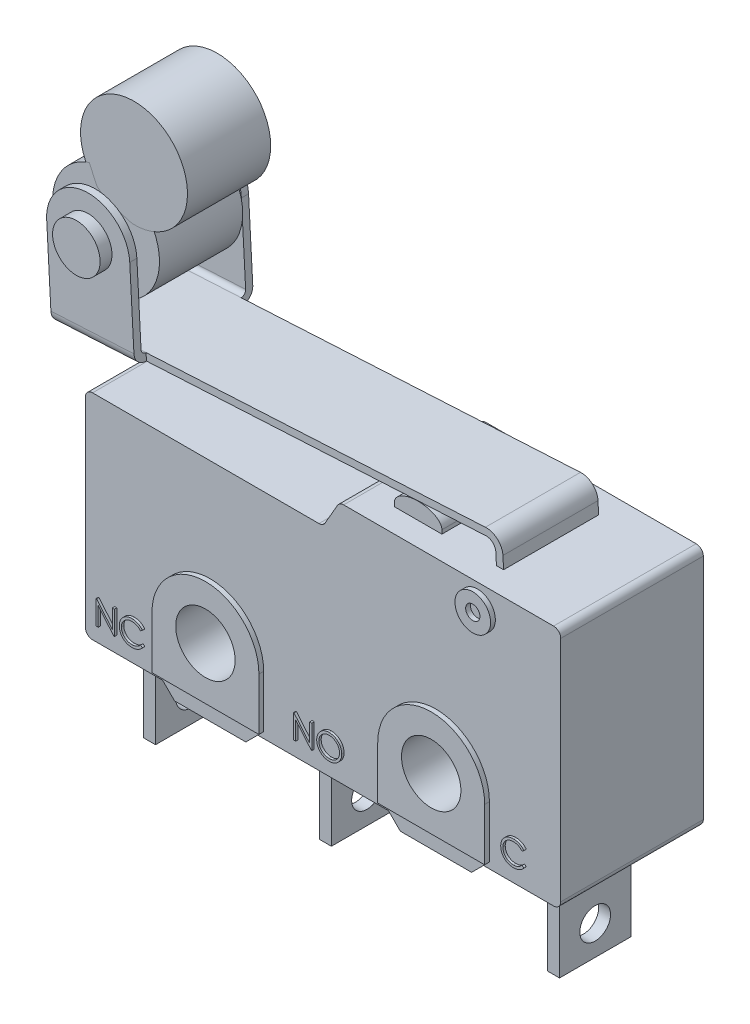
from build123d import *

# Parameters (mm, degrees)
ESQUISSE1_R             = 1.2500000000000009
ESQUISSE1_R_2           = 1.2500000000000016
BOSS_EXTRU_1_DEPTH      = 3
ESQUISSE2_R             = 0.75
ESQUISSE2_R_2           = 0.3000000000000001
ESQUISSE2_R_3           = 1.250000000000001
BOSS_EXTRU_2_DEPTH      = 3.2
ESQUISSE3_W             = 0.38461538461538436
ESQUISSE3_H             = 0.1025641025641022
BOSS_EXTRU_3_DEPTH      = 0.1
BOSS_EXTRU_4_DEPTH      = 2
BOSS_EXTRU_5_DEPTH      = 0.1
BOSS_EXTRU_6_DEPTH      = 0.1
BOSS_EXTRU_15_DEPTH     = 2
BOSS_EXTRU_16_DEPTH     = 2.5
ENL_V_MAT_EXTRU_1_DEPTH = 2.2
ESQUISSE12_R            = 1.0000000000000018
BOSS_EXTRU_17_DEPTH     = 3
ESQUISSE13_R            = 2.250000000000001
BOSS_EXTRU_18_DEPTH     = 1.75
CONG_1_R                = 0.2
CONG_2_R                = 0.5
BOSS_EXTRU_19_DEPTH     = 1.5
BOSS_EXTRU_19_2_DEPTH   = 1.5
ESQUISSE15_W            = 0.5000000000000018
ESQUISSE15_H            = 4
BOSS_EXTRU_19_3_DEPTH   = 1.5
ESQUISSE16_R            = 0.6469837628612904
ENL_V_MAT_EXTRU_2_DEPTH = 26.529102572036283
ESQUISSE17_R            = 2.2500000000000013
BOSS_EXTRU_20_DEPTH     = 1.75


with BuildPart() as part:
    # Esquisse1 → Boss.-Extru.1 (new, symmetric)
    with BuildSketch(Plane.XY):
        with BuildLine():
            Line((-6.500000000000009, 4.15e-15), (-9.500000000000009, 3.53e-15))
            Line((-9.500000000000009, 3.53e-15), (-10.000000000000004, 0.49999999999999956))
            Line((-10.000000000000004, 0.49999999999999956), (-12.950000000000001, 0.49999999999999906))
            ThreePointArc((-12.950000000000001, 0.49999999999999906), (-13.162132034355965, 0.5878679656440349), (-13.250000000000002, 0.7999999999999992))
            Line((-13.250000000000002, 0.7999999999999992), (-13.250000000000002, 9.2))
            ThreePointArc((-13.250000000000002, 9.2), (-13.162132034355967, 9.412132034355967), (-12.95, 9.500000000000002))
            Line((-12.95, 9.500000000000002), (-3.4232050807568895, 9.500000000000002))
            ThreePointArc((-3.4232050807568895, 9.500000000000002), (-3.273205080756889, 9.54019237886467), (-3.1633974596215575, 9.650000000000002))
            Line((-3.1633974596215575, 9.650000000000002), (-2.643782217350898, 10.55))
            ThreePointArc((-2.643782217350898, 10.55), (-2.533974596215567, 10.659807621135332), (-2.3839745962155665, 10.700000000000003))
            Line((-2.3839745962155665, 10.700000000000003), (6.4499999999999975, 10.700000000000001))
            ThreePointArc((6.4499999999999975, 10.700000000000001), (6.662132034355963, 10.612132034355966), (6.749999999999999, 10.4))
            Line((6.749999999999999, 10.4), (6.749999999999999, 0.8000000000000015))
            ThreePointArc((6.749999999999999, 0.8000000000000015), (6.662132034355964, 0.587867965644038), (6.45, 0.5000000000000016))
            Line((6.45, 0.5000000000000016), (3.5, 0.5000000000000013))
            Line((3.5, 0.5000000000000013), (2.999999999999999, -4.6e-16))
            Line((2.999999999999999, -4.6e-16), (0, 0))
            Line((0, 0), (-0.4999999999999999, 0.5000000000000008))
            Line((-0.4999999999999999, 0.5000000000000008), (-5.999999999999996, 0.5000000000000001))
            Line((-5.999999999999996, 0.5000000000000001), (-6.500000000000009, 4.15e-15))
        make_face()
        with Locations((-8, 2.950000000000001)):
            Circle(ESQUISSE1_R, mode=Mode.SUBTRACT)
        with Locations((1.4999999999999996, 2.950000000000001)):
            Circle(ESQUISSE1_R_2, mode=Mode.SUBTRACT)
    extrude(amount=BOSS_EXTRU_1_DEPTH, both=True)

    # Esquisse2 → Boss.-Extru.2 (add, symmetric)
    # profile 1 of 3: a face of its own
    with BuildSketch(Plane.XY):
        with Locations((3.25, 9.700000000000001)):
            Circle(ESQUISSE2_R)
        with Locations((3.25, 9.700000000000001)):
            Circle(ESQUISSE2_R_2, mode=Mode.SUBTRACT)
    # profile 2 of 3: a face of its own
    with BuildSketch(Plane.XY):
        with BuildLine():
            Line((-10.25, 0.7500000000000012), (-5.75, 0.7500000000000012))
            Line((-5.75, 0.7500000000000012), (-5.75, 2.950000000000001))
            ThreePointArc((-5.75, 2.950000000000001), (-8, 5.200000000000001), (-10.249999999999998, 2.9500000000000006))
            Line((-10.249999999999998, 2.9500000000000006), (-10.25, 0.7500000000000012))
        make_face()
        with Locations((-8, 2.950000000000001)):
            Circle(ESQUISSE2_R_3, mode=Mode.SUBTRACT)
    # profile 3 of 3: a face of its own
    with BuildSketch(Plane.XY):
        with BuildLine():
            Line((-0.7499999999999989, 2.9500000000000006), (-0.7500000000000007, 0.7500000000000012))
            Line((-0.7500000000000007, 0.7500000000000012), (3.75, 0.7500000000000012))
            Line((3.75, 0.7500000000000012), (3.75, 2.950000000000001))
            ThreePointArc((3.75, 2.950000000000001), (1.4999999999999998, 5.200000000000001), (-0.7499999999999989, 2.9500000000000006))
        make_face()
        with Locations((1.4999999999999996, 2.950000000000001)):
            Circle(ESQUISSE2_R_3, mode=Mode.SUBTRACT)
    extrude(amount=BOSS_EXTRU_2_DEPTH, both=True)

    # Esquisse3 → Boss.-Extru.3 (add)
    # profile 1 of 16: a face of its own
    with BuildSketch(Plane(origin=(0, 0, -3), x_dir=(-1, 0, 0), z_dir=(0, 0, -1))):
        with BuildLine():
            Line((-3.3711910034852886, 7.068374541772134), (-3.3711910034852886, 6.965810439208032))
            Line((-3.3711910034852886, 6.965810439208032), (-3.7113352342545194, 6.965810439208032))
            Line((-3.7113352342545194, 6.965810439208032), (-3.7652214522032375, 6.702789605874698))
            add(Edge.make_bspline(
                [(-3.7652214522032375, 6.702789605874698), (-3.7546340595250465, 6.705712540677629), (-3.7341226607157965, 6.711375264566191), (-3.7038484147261608, 6.717662627546043), (-3.675107785163021, 6.72145275441961), (-3.6564576793314476, 6.721970271708806), (-3.6474329906647758, 6.722220695618288)],
                knots=[0, 0, 0, 0, 1.1002734760749815, 2.1316058403597524, 3.0958938383697827, 4, 4, 4, 4], degree=3))
            add(Edge.make_bspline(
                [(-3.6474329906647758, 6.722220695618288), (-3.6362662078898613, 6.721978999705534), (-3.614309522939824, 6.721503765153467), (-3.582184109513073, 6.716940379597952), (-3.5515175685936105, 6.709757546846453), (-3.5223740342575107, 6.699723112064541), (-3.4946995912182888, 6.686891759723301), (-3.4687488593667113, 6.670863205335353), (-3.4441323127990455, 6.652139396435454), (-3.4212915716692827, 6.630612250161277), (-3.4005703407648755, 6.606920359660658), (-3.382351486574309, 6.581446682219663), (-3.366876460773088, 6.554438778752642), (-3.354430530808396, 6.525638604827437), (-3.3444921495866975, 6.495364560995902), (-3.3378772939170376, 6.463298108838117), (-3.3334725199280983, 6.429741503120009), (-3.332980409551074, 6.406797340240815), (-3.33272946502375, 6.395097298182391)],
                knots=[0, 0, 0, 0, 1.052922332971118, 2.070308378688888, 3.0543049701150435, 4.020497102877372, 4.973039431444365, 5.925935799171929, 6.892292201435622, 7.886100009880045, 8.881663170484007, 9.857072815901471, 10.836096530794462, 11.812156883185862, 12.812194150020737, 13.83644130519176, 14.896724719990463, 15.999999999999998, 15.999999999999998, 15.999999999999998, 15.999999999999998], degree=3))
            add(Edge.make_bspline(
                [(-3.33272946502375, 6.395097298182391), (-3.3329194865304275, 6.386948092367545), (-3.333296961567543, 6.370759810203018), (-3.335216558038339, 6.346718610007219), (-3.3389124769138196, 6.3231863719836925), (-3.34387468380069, 6.300159974315491), (-3.3503153746479772, 6.277683010835742), (-3.358112247191499, 6.255691145713806), (-3.3676539693371725, 6.234321258072904), (-3.3781200765540085, 6.213371145208967), (-3.3899047845640986, 6.193314428867619), (-3.4029843580895163, 6.174557575569709), (-3.4168030698673237, 6.156819209432581), (-3.4316720371411185, 6.140289571429959), (-3.447729464316146, 6.125077280603387), (-3.46478088341949, 6.11109205731598), (-3.482690231713526, 6.098097391515094), (-3.501734586662371, 6.086620764322093), (-3.521489581794819, 6.076059919707009), (-3.542240500977813, 6.067396051896911), (-3.5635149868228155, 6.059650186729782), (-3.585619236992768, 6.053476035983612), (-3.6085031834544146, 6.0486381632638055), (-3.632204547877869, 6.045352277377385), (-3.656599025027511, 6.0429590095287455), (-3.6731347429074748, 6.0428091932571375), (-3.681487477844263, 6.042733516131109)],
                knots=[0, 0, 0, 0, 1.0563472938273533, 2.098418968024932, 3.1228415677895556, 4.14128866939639, 5.149314143235321, 6.151154210331126, 7.162517403198004, 8.18037606211429, 9.185164535208633, 10.174177089780748, 11.141909838010019, 12.097768115083088, 13.052685740843792, 14.005601399511681, 14.954263652455996, 15.917497458446022, 16.885230206675274, 17.85450947246843, 18.828990115202213, 19.81800266977433, 20.82617672132415, 21.85788393677542, 22.91794672539547, 23.999999999999996, 23.999999999999996, 23.999999999999996, 23.999999999999996], degree=3))
            add(Edge.make_bspline(
                [(-3.681487477844263, 6.042733516131109), (-3.691451529473466, 6.042930898412298), (-3.711054623960291, 6.04331922473297), (-3.7397747859807375, 6.047381649091279), (-3.7674075304645847, 6.053199910917718), (-3.793730416509561, 6.061953130874391), (-3.818979348996772, 6.072920929357311), (-3.8428144112221583, 6.086782692641718), (-3.8658446329501213, 6.102491007998018), (-3.8871337863071225, 6.121028251702241), (-3.906892675869878, 6.141289875140104), (-3.924580249832832, 6.16327777261603), (-3.940332700329019, 6.186629041783485), (-3.95389777089726, 6.211457085805119), (-3.965468634130517, 6.237696666073015), (-3.9745586307810035, 6.265446094899286), (-3.981895303621894, 6.294560381739114), (-3.9849991380437104, 6.314604241856409), (-3.986575618869904, 6.324784798182391)],
                knots=[0, 0, 0, 0, 1.0467383001422814, 2.0593339501101195, 3.0437782698166163, 4.011590432536625, 4.970194870615103, 5.932262532635629, 6.905835910597633, 7.896367577061666, 8.89413528604054, 9.877477877096155, 10.858688625556418, 11.851381752722359, 12.847765800203907, 13.868841284248289, 14.91755474153421, 16, 16, 16, 16], degree=3))
            Line((-3.986575618869904, 6.324784798182391), (-3.8968320291263145, 6.324784798182391))
            add(Edge.make_bspline(
                [(-3.8968320291263145, 6.324784798182391), (-3.894623869871982, 6.315248668911347), (-3.89037966517459, 6.29691969894793), (-3.8810637369597383, 6.27116788713848), (-3.869673486824675, 6.248219537516764), (-3.8561293872768827, 6.2277710851528925), (-3.839972235709391, 6.2099399430750895), (-3.8215352560120617, 6.194049353950014), (-3.8008644779551406, 6.1797136027135755), (-3.7778949838065987, 6.167764240657201), (-3.75366267542935, 6.157573168257193), (-3.72830061542661, 6.150786969699573), (-3.702499373577727, 6.1460152860302), (-3.685048410664443, 6.145537640086869), (-3.67627914451093, 6.145297618695212)],
                knots=[0, 0, 0, 0, 1.136247022410648, 2.183929868487286, 3.172523383326136, 4.106158343373255, 5.023411330345773, 5.958108904462903, 6.928429099340789, 7.938127109450389, 8.96079060995037, 9.975095811932924, 10.98246739456387, 12, 12, 12, 12], degree=3))
            add(Edge.make_bspline(
                [(-3.67627914451093, 6.145297618695212), (-3.6677195889631333, 6.1455321266680984), (-3.6508657540521114, 6.145993874785542), (-3.6260625007112535, 6.149547878239787), (-3.602115965224928, 6.155021470041962), (-3.579262434722367, 6.1632128571801825), (-3.5571019948397824, 6.173168491016129), (-3.536195203290327, 6.185944226963523), (-3.515937238392993, 6.200647089376381), (-3.496957771672692, 6.21749184081735), (-3.479575071884248, 6.236054610708564), (-3.4642161801316997, 6.255905294544253), (-3.451422776295656, 6.277081536413647), (-3.4406416023328883, 6.2992167229424805), (-3.4324549455264215, 6.322553453564893), (-3.42661466517705, 6.346982360757014), (-3.4231852198003367, 6.3725637836731375), (-3.42271345409406, 6.390012157894913), (-3.42247305476734, 6.39890338792598)],
                knots=[0, 0, 0, 0, 1.0273167245277883, 2.0227950364758875, 3.002884548238771, 3.971462791283416, 4.93288096013782, 5.914575861202308, 6.907176828588507, 7.935150275340233, 8.956128383553937, 9.956726525218546, 10.942570164546778, 11.921478528906006, 12.90784360622869, 13.905385889939256, 14.9326400475968, 16, 16, 16, 16], degree=3))
            add(Edge.make_bspline(
                [(-3.42247305476734, 6.39890338792598), (-3.422661191756326, 6.406925031246322), (-3.4230294431432955, 6.422626256690663), (-3.426038177515569, 6.445597458531017), (-3.4312715981880557, 6.467332613474331), (-3.4385355638871866, 6.487936680323463), (-3.447758280382501, 6.5074290924229015), (-3.4590286553307363, 6.525829966765816), (-3.4725581976003084, 6.542896776258239), (-3.4880130229113564, 6.558637505860954), (-3.504943891752236, 6.573164612967556), (-3.5236421039228447, 6.585548637668113), (-3.5437163687214577, 6.595966899854351), (-3.56492482571256, 6.60495775652371), (-3.587771939594674, 6.611415112352094), (-3.611805263131645, 6.616263079621264), (-3.6372843225450615, 6.61906746895791), (-3.6547045191547625, 6.619456579922412), (-3.6636589522032375, 6.619656593054186)],
                knots=[0, 0, 0, 0, 1.0456221124254999, 2.0466565092898, 3.0137632891472275, 3.9554572362472515, 4.89008206715859, 5.8203174373091, 6.762574622604487, 7.722996705446269, 8.69280353983296, 9.665887285169648, 10.639438260244559, 11.638615905801052, 12.663482002390786, 13.728887083665608, 14.832589033839156, 16, 16, 16, 16], degree=3))
            add(Edge.make_bspline(
                [(-3.6636589522032375, 6.619656593054186), (-3.6714100747193585, 6.619490709866306), (-3.687414176240702, 6.619148203168211), (-3.7119635553062054, 6.616626346932116), (-3.7377611904424137, 6.6125579770955065), (-3.764708189172757, 6.606961906390025), (-3.7928854772021876, 6.599638741601843), (-3.822233591695695, 6.590863169994542), (-3.8528142392954914, 6.580371170362087), (-3.873419303409418, 6.5724476807201775), (-3.8840115163058018, 6.568374541772134)],
                knots=[0, 0, 0, 0, 0.8176242962817476, 1.6881867389910008, 2.600797292521655, 3.5720167770791047, 4.590301741190848, 5.671205678128523, 6.802862970347198, 8, 8, 8, 8], degree=3))
            Line((-3.8840115163058018, 6.568374541772134), (-3.781447413741699, 7.068374541772134))
            Line((-3.781447413741699, 7.068374541772134), (-3.3711910034852886, 7.068374541772134))
        make_face()
    # profile 2 of 16: a face of its own
    with BuildSketch(Plane(origin=(0, 0, -3), x_dir=(-1, 0, 0), z_dir=(0, 0, -1))):
        Polygon((-2.7301653624596476, 7.068374541772134), (-2.268626900921186, 6.068374541772134), (-2.3661829906647758, 6.068374541772134), (-2.514019529126314, 6.3888873622849545), (-2.9673448496391344, 6.3888873622849545), (-3.1193881188699044, 6.068374541772134), (-3.217344849639135, 6.068374541772134), (-2.7429858752801604, 7.068374541772134), align=None)
        Polygon((-2.737577221434006, 6.873462682797776), (-2.9186669650237507, 6.4914514648490576), (-2.5612951701519555, 6.4914514648490576), align=None, mode=Mode.SUBTRACT)
    # profile 3 of 16: a face of its own
    with BuildSketch(Plane(origin=(0, 0, -3), x_dir=(-1, 0, 0), z_dir=(0, 0, -1))):
        Polygon((-1.5817278624596474, 7.068374541772134), (-1.3968320291263139, 7.068374541772134), (-1.3968320291263139, 6.068374541772134), (-1.486575618869904, 6.068374541772134), (-1.486575618869904, 6.965810439208032), (-1.6404217727160577, 6.965810439208032), align=None)
    # profile 4 of 16: a face of its own
    with BuildSketch(Plane(origin=(0, 0, -3), x_dir=(-1, 0, 0), z_dir=(0, 0, -1))):
        with BuildLine():
            Line((-0.896832029126314, 6.760682234079828), (-0.9865756188699036, 6.760682234079828))
            add(Edge.make_bspline(
                [(-0.9865756188699036, 6.760682234079828), (-0.9859907180104952, 6.772588202013484), (-0.9848419882887761, 6.795971206177741), (-0.9794624770711364, 6.8300637508631965), (-0.971765083584031, 6.862650836213157), (-0.9608818110083724, 6.893470811633059), (-0.9473657316455816, 6.922796185127436), (-0.9311571523938983, 6.950510475324947), (-0.9119589093900639, 6.976507957814834), (-0.8901855568056547, 7.0005476273278235), (-0.8665373742185117, 7.022601218984778), (-0.8410213915125007, 7.041645574072254), (-0.8142085265735564, 7.057736337318531), (-0.786180126869158, 7.071188120696773), (-0.7566199658521712, 7.0812852195317815), (-0.7257962921837587, 7.0887771165616655), (-0.6935736817810622, 7.093284643910687), (-0.6716193897676528, 7.093769154083343), (-0.6604538239981089, 7.094015567413161)],
                knots=[0, 0, 0, 0, 1.1006527102498858, 2.161652630898041, 3.183658788970416, 4.1904687964937, 5.175919509887512, 6.163126047456814, 7.151507819852391, 8.156236427250109, 9.156009101557892, 10.134482810578449, 11.092018606748036, 12.04133060457071, 13.00126825845474, 13.972401358723069, 14.968799086320466, 15.999999999999998, 15.999999999999998, 15.999999999999998, 15.999999999999998], degree=3))
            add(Edge.make_bspline(
                [(-0.6604538239981089, 7.094015567413161), (-0.6494886599731539, 7.093758865571609), (-0.6279425043570366, 7.093254455622757), (-0.596496214513355, 7.088922732974976), (-0.5665598446666743, 7.082138278222035), (-0.538191911374702, 7.072619587846809), (-0.511618750068631, 7.059824037163229), (-0.4866407373382462, 7.044453311832329), (-0.46296050568367375, 7.026676217154568), (-0.4416442817944853, 7.005746556169312), (-0.42207054486984125, 6.983403017749209), (-0.40518418625719027, 6.959549331002881), (-0.39072328240766957, 6.934912392227161), (-0.3786696595844743, 6.909304334632444), (-0.3697964770304383, 6.882484040800247), (-0.3630598461649031, 6.854841982859775), (-0.35925201368259146, 6.826092036857899), (-0.3586676069689196, 6.806633020958544), (-0.3583704906647755, 6.796739926387519)],
                knots=[0, 0, 0, 0, 1.1116073639947224, 2.184268761884779, 3.212621177748175, 4.221274765693212, 5.21176036744672, 6.196651075444664, 7.192147500201631, 8.207485112727051, 9.220403447888982, 10.201281604222782, 11.166441694673628, 12.114753414831751, 13.065576455818492, 14.02645073428511, 14.996634278563837, 16, 16, 16, 16], degree=3))
            add(Edge.make_bspline(
                [(-0.3583704906647755, 6.796739926387519), (-0.35885428005234177, 6.782811973651855), (-0.3598133690086761, 6.755200484031705), (-0.3680174765993662, 6.714624808960509), (-0.38083076548378203, 6.675312403507174), (-0.39625858172645145, 6.64367317434019), (-0.4118221371726471, 6.6181778904096085), (-0.42584713934225954, 6.597186831861111), (-0.4422656567770621, 6.57458526946414), (-0.4613166561949725, 6.5504488873572955), (-0.4826060482380405, 6.524588628757707), (-0.5063266663399357, 6.497020115786733), (-0.5326476612031927, 6.468028181552433), (-0.5511215185615757, 6.44822658115591), (-0.5606942086134937, 6.437965887925981)],
                knots=[0, 0, 0, 0, 1.1844263556738217, 2.3480677057279653, 3.509069118095439, 4.696110525597893, 5.3335492880626925, 6.050745305391797, 6.844228055936134, 7.710549037172967, 8.667450064128206, 9.695053472192528, 10.805634455820167, 12, 12, 12, 12], degree=3))
            Line((-0.5606942086134937, 6.437965887925981), (-0.8108945291263139, 6.170938644336237))
            Line((-0.8108945291263139, 6.170938644336237), (-0.3455499778442627, 6.170938644336237))
            Line((-0.3455499778442627, 6.170938644336237), (-0.3455499778442627, 6.068374541772134))
            Line((-0.3455499778442627, 6.068374541772134), (-1.0250371573314425, 6.068374541772134))
            Line((-1.0250371573314425, 6.068374541772134), (-0.6372166445109293, 6.482236721259314))
            add(Edge.make_bspline(
                [(-0.6372166445109293, 6.482236721259314), (-0.6277743911372567, 6.492093380273202), (-0.6096377548175707, 6.51102600501726), (-0.5839855900149412, 6.538666850769837), (-0.5609458790685401, 6.564309576699014), (-0.5403694811337335, 6.587905733397436), (-0.5227027653149271, 6.609800467053299), (-0.5070249847584187, 6.629284668078371), (-0.4944633873349705, 6.6472145110234875), (-0.4808304171384921, 6.667997543569926), (-0.4676264224532858, 6.693372491333941), (-0.4562800350131728, 6.724382116837098), (-0.44936150688499465, 6.756304189030238), (-0.4485315538833302, 6.7778761996151715), (-0.4481140804083652, 6.788727105874699)],
                knots=[0, 0, 0, 0, 1.32963172561582, 2.5539504281732377, 3.673215717877323, 4.687767853392123, 5.6030936323302205, 6.413772471408342, 7.12304329158807, 7.7346840541046005, 8.834405431552456, 9.900288307426358, 10.943827017957098, 12, 12, 12, 12], degree=3))
            add(Edge.make_bspline(
                [(-0.4481140804083652, 6.788727105874699), (-0.4482957210653422, 6.795550362563501), (-0.44865369992008164, 6.808997691238162), (-0.45181304206116796, 6.828713622386337), (-0.45658747237388475, 6.847732140619421), (-0.46342897467329414, 6.86611174608166), (-0.472459471840534, 6.883667646671997), (-0.48345186610270463, 6.900421212444455), (-0.49613474136495184, 6.916618059644477), (-0.5108065326023429, 6.931804716232499), (-0.5269241096899379, 6.9457136320846296), (-0.5439510381428612, 6.958034799345876), (-0.5619653536456923, 6.96833168814554), (-0.580891102838784, 6.976772687339948), (-0.6006755226697429, 6.983394224824616), (-0.6213568784189978, 6.987982390374077), (-0.6428780259282841, 6.990863100073114), (-0.6575733104113238, 6.9912528634755065), (-0.6650611957929806, 6.9914514648490576)],
                knots=[0, 0, 0, 0, 0.9914464109929845, 1.9539504902127267, 2.8958159495974547, 3.8389314632304177, 4.798493297704389, 5.759821559631791, 6.74841186786633, 7.785213222738008, 8.824556873915855, 9.840280684159671, 10.836137866586514, 11.835679397803412, 12.848801642607217, 13.863922112251181, 14.91157558683439, 16, 16, 16, 16], degree=3))
            add(Edge.make_bspline(
                [(-0.6650611957929806, 6.9914514648490576), (-0.6728814337233592, 6.991247169916506), (-0.6882390897860904, 6.990845968400973), (-0.7107873849108161, 6.988039492974681), (-0.732297607060491, 6.9831978242898405), (-0.7528238650470388, 6.976575917322122), (-0.7724008895649606, 6.968159189087171), (-0.7909334735756248, 6.957675833464666), (-0.8083800133641723, 6.945166263992512), (-0.8247733057485994, 6.9309832478999285), (-0.8398772997667546, 6.915192504695376), (-0.8531478357281596, 6.89758965810482), (-0.8647432683406263, 6.878496110855937), (-0.8748601921919972, 6.857963382121837), (-0.8830761036442171, 6.835805159269119), (-0.8893541466245316, 6.812100100740992), (-0.8943218171164211, 6.786951134615692), (-0.8959813944320926, 6.769583967513815), (-0.896832029126314, 6.760682234079828)],
                knots=[0, 0, 0, 0, 1.0310187455238864, 2.0247505803468515, 2.99019445498514, 3.9340405694313016, 4.864654155060279, 5.7950594891625755, 6.735614924666334, 7.690564532474664, 8.649604399260141, 9.611025573591272, 10.59097263611516, 11.591080094623736, 12.624614302107895, 13.701020112815922, 14.821632451293825, 16, 16, 16, 16], degree=3))
        make_face()
    # profile 5 of 16: a face of its own
    with BuildSketch(Plane(origin=(0, 0, -3), x_dir=(-1, 0, 0), z_dir=(0, 0, -1))):
        with BuildLine():
            Line((0.3723987401044555, 7.068374541772134), (0.3723987401044555, 6.965810439208032))
            Line((0.3723987401044555, 6.965810439208032), (0.03225450933522483, 6.965810439208032))
            Line((0.03225450933522483, 6.965810439208032), (-0.02163170861349366, 6.702789605874698))
            add(Edge.make_bspline(
                [(-0.02163170861349366, 6.702789605874698), (-0.01104431593530271, 6.705712540677629), (0.00946708287394745, 6.711375264566191), (0.03974132886358294, 6.717662627546043), (0.06848195842672278, 6.72145275441961), (0.08713206425829612, 6.721970271708806), (0.09615675292496806, 6.722220695618288)],
                knots=[0, 0, 0, 0, 1.1002734760749815, 2.1316058403597524, 3.095893838369768, 4, 4, 4, 4], degree=3))
            add(Edge.make_bspline(
                [(0.09615675292496806, 6.722220695618288), (0.10732353569988283, 6.721978999705534), (0.12928022064991998, 6.721503765153467), (0.1614056340766711, 6.716940379597953), (0.19207217499613344, 6.709757546846453), (0.22121570933223295, 6.69972311206454), (0.24889015237145556, 6.686891759723301), (0.2748408842230328, 6.670863205335353), (0.2994574307906987, 6.652139396435455), (0.3222981719204617, 6.630612250161277), (0.343019402824868, 6.606920359660658), (0.36123825701543516, 6.581446682219663), (0.3767132828166554, 6.554438778752641), (0.38915921278134824, 6.525638604827437), (0.39909759400304634, 6.495364560995902), (0.40571244967270575, 6.463298108838117), (0.4101172236616454, 6.429741503120009), (0.4106093340386696, 6.406797340240815), (0.41086027856599394, 6.395097298182391)],
                knots=[0, 0, 0, 0, 1.0529223329711177, 2.0703083786889014, 3.0543049701150444, 4.020497102877372, 4.973039431444378, 5.925935799171918, 6.892292201435633, 7.886100009880046, 8.881663170484007, 9.85707281590148, 10.836096530794464, 11.81215688318587, 12.81219415002074, 13.836441305191764, 14.896724719990466, 16, 16, 16, 16], degree=3))
            add(Edge.make_bspline(
                [(0.41086027856599394, 6.395097298182391), (0.4106702570593164, 6.386948092367545), (0.41029278202220043, 6.370759810203018), (0.4083731855514051, 6.346718610007219), (0.40467726667592424, 6.3231863719836925), (0.39971505978905386, 6.300159974315491), (0.3932743689417666, 6.277683010835742), (0.38547749639824486, 6.255691145713806), (0.37593577425257146, 6.234321258072904), (0.3654696670357359, 6.213371145208967), (0.3536849590256457, 6.193314428867619), (0.3406053855002275, 6.174557575569709), (0.32678667372242026, 6.156819209432581), (0.3119177064486257, 6.140289571429957), (0.2958602792735983, 6.125077280603387), (0.2788088601702534, 6.11109205731598), (0.2608995118762177, 6.098097391515094), (0.24185515692737267, 6.086620764322093), (0.22210016179492492, 6.076059919707009), (0.2013492426119301, 6.067396051896911), (0.18007475676692816, 6.059650186729782), (0.15797050659697598, 6.053476035983612), (0.1350865601353295, 6.0486381632638055), (0.11138519571187509, 6.045352277377385), (0.08699071856223244, 6.0429590095287455), (0.07045500068226905, 6.0428091932571375), (0.06210226574548082, 6.042733516131109)],
                knots=[0, 0, 0, 0, 1.0563472938273533, 2.098418968024932, 3.1228415677895556, 4.14128866939639, 5.149314143235321, 6.151154210331126, 7.162517403197997, 8.180376062114282, 9.185164535208635, 10.17417708978075, 11.14190983801002, 12.097768115083076, 13.052685740843796, 14.005601399511683, 14.954263652455998, 15.917497458446025, 16.885230206675296, 17.854509472468447, 18.828990115202235, 19.81800266977433, 20.82617672132415, 21.85788393677544, 22.91794672539547, 23.999999999999996, 23.999999999999996, 23.999999999999996, 23.999999999999996], degree=3))
            add(Edge.make_bspline(
                [(0.06210226574548082, 6.042733516131109), (0.0521382141162782, 6.042930898412298), (0.03253511962945363, 6.04331922473297), (0.00381495760900661, 6.047381649091279), (-0.02381778687484, 6.053199910917718), (-0.05014067291981742, 6.061953130874391), (-0.07538960540702858, 6.072920929357311), (-0.09922466763241394, 6.086782692641718), (-0.12225488936037744, 6.102491007998018), (-0.14354404271737853, 6.121028251702241), (-0.1633029322801349, 6.141289875140102), (-0.18099050624308707, 6.16327777261603), (-0.1967429567392746, 6.186629041783485), (-0.21030802730751602, 6.211457085805119), (-0.22187889054077137, 6.237696666073015), (-0.23096888719125866, 6.265446094899286), (-0.23830556003215086, 6.294560381739114), (-0.2414093944539668, 6.314604241856409), (-0.24298587528016025, 6.324784798182391)],
                knots=[0, 0, 0, 0, 1.046738300142266, 2.059333950110119, 3.0437782698166154, 4.011590432536624, 4.970194870615102, 5.932262532635628, 6.905835910597632, 7.896367577061664, 8.894135286040548, 9.877477877096146, 10.85868862555641, 11.851381752722357, 12.8477658002039, 13.868841284248285, 14.917554741534211, 15.999999999999998, 15.999999999999998, 15.999999999999998, 15.999999999999998], degree=3))
            Line((-0.24298587528016025, 6.324784798182391), (-0.15324228553657057, 6.324784798182391))
            add(Edge.make_bspline(
                [(-0.15324228553657057, 6.324784798182391), (-0.15103412628223808, 6.315248668911347), (-0.14678992158484577, 6.29691969894793), (-0.13747399336999394, 6.27116788713848), (-0.12608374323493157, 6.248219537516764), (-0.1125396436871388, 6.2277710851528925), (-0.09638249211964729, 6.2099399430750895), (-0.07794551242231819, 6.194049353950014), (-0.05727473436539646, 6.1797136027135755), (-0.03430524021685466, 6.167764240657201), (-0.01007293183960614, 6.157573168257193), (0.01528912816313358, 6.150786969699573), (0.04109037001201634, 6.1460152860302), (0.05854133292530109, 6.145537640086869), (0.06731059907881445, 6.145297618695212)],
                knots=[0, 0, 0, 0, 1.1362470224106467, 2.183929868487283, 3.1725233833261317, 4.10615834337325, 5.023411330345767, 5.958108904462895, 6.92842909934078, 7.938127109450378, 8.96079060995036, 9.975095811932912, 10.982467394563855, 12, 12, 12, 12], degree=3))
            add(Edge.make_bspline(
                [(0.06731059907881445, 6.145297618695212), (0.07587015462661088, 6.1455321266680984), (0.09272398953763228, 6.145993874785542), (0.11752724287849041, 6.149547878239787), (0.1414737783648157, 6.155021470041962), (0.16432730886737723, 6.1632128571801825), (0.18648774874996135, 6.173168491016129), (0.2073945402994171, 6.185944226963523), (0.22765250519675054, 6.200647089376382), (0.24663197191705236, 6.21749184081735), (0.26401467170549503, 6.236054610708564), (0.2793735634580439, 6.255905294544253), (0.29216696729408737, 6.277081536413647), (0.3029481412568553, 6.2992167229424805), (0.3111347980633214, 6.322553453564893), (0.3169750784126942, 6.346982360757014), (0.3204045237894069, 6.3725637836731375), (0.32087628949568403, 6.390012157894913), (0.32111668882240424, 6.39890338792598)],
                knots=[0, 0, 0, 0, 1.027316724527772, 2.0227950364758893, 3.0028845482387574, 3.971462791283403, 4.932880960137808, 5.914575861202297, 6.907176828588497, 7.935150275340237, 8.956128383553919, 9.956726525218537, 10.94257016454677, 11.921478528905999, 12.90784360622868, 13.90538588993925, 14.932640047596797, 16, 16, 16, 16], degree=3))
            add(Edge.make_bspline(
                [(0.32111668882240424, 6.39890338792598), (0.32092855183341784, 6.406925031246322), (0.32056030044644773, 6.422626256690663), (0.31755156607417523, 6.445597458531017), (0.3123181454016888, 6.467332613474331), (0.30505417970255694, 6.487936680323463), (0.29583146320724335, 6.5074290924229015), (0.2845610882590075, 6.525829966765816), (0.2710315459894358, 6.542896776258239), (0.2555767206783877, 6.558637505860954), (0.23864585183750803, 6.573164612967556), (0.2199476396668993, 6.5855486376681105), (0.19987337486828624, 6.595966899854351), (0.17866491787718414, 6.60495775652371), (0.15581780399506967, 6.611415112352094), (0.13178448045809865, 6.616263079621264), (0.1063054210446826, 6.61906746895791), (0.08888522443498138, 6.619456579922412), (0.07993079138650644, 6.619656593054186)],
                knots=[0, 0, 0, 0, 1.0456221124255014, 2.0466565092897993, 3.013763289147226, 3.95545723624725, 4.8900820671585805, 5.820317437309102, 6.762574622604489, 7.722996705446283, 8.69280353983296, 9.665887285169662, 10.639438260244559, 11.638615905801052, 12.663482002390769, 13.728887083665589, 14.832589033839156, 16, 16, 16, 16], degree=3))
            add(Edge.make_bspline(
                [(0.07993079138650644, 6.619656593054186), (0.07217966887038532, 6.619490709866306), (0.05617556734904172, 6.619148203168211), (0.03162618828353807, 6.616626346932116), (0.00582855314733021, 6.6125579770955065), (-0.02111844558301279, 6.606961906390025), (-0.04929573361244362, 6.599638741601843), (-0.07864384810595086, 6.590863169994542), (-0.10922449570574772, 6.580371170362087), (-0.12982955981967423, 6.5724476807201775), (-0.14042177271605777, 6.568374541772134)],
                knots=[0, 0, 0, 0, 0.8176242962817476, 1.6881867389910008, 2.600797292521655, 3.57201677707912, 4.590301741190833, 5.671205678128537, 6.8028629703471974, 8, 8, 8, 8], degree=3))
            Line((-0.14042177271605777, 6.568374541772134), (-0.03785767015195528, 7.068374541772134))
            Line((-0.03785767015195528, 7.068374541772134), (0.3723987401044555, 7.068374541772134))
        make_face()
    # profile 6 of 16: a face of its own
    with BuildSketch(Plane(origin=(0, 0, -3), x_dir=(-1, 0, 0), z_dir=(0, 0, -1))):
        with Locations((0.7057320734377885, 6.452989926387518)):
            Rectangle(ESQUISSE3_W, ESQUISSE3_H)
    # profile 7 of 16: a face of its own
    with BuildSketch(Plane(origin=(0, 0, -3), x_dir=(-1, 0, 0), z_dir=(0, 0, -1))):
        with BuildLine():
            Line((1.1031679708736857, 6.760682234079828), (1.013424381130096, 6.760682234079828))
            add(Edge.make_bspline(
                [(1.013424381130096, 6.760682234079828), (1.0140092819895046, 6.772588202013484), (1.0151580117112242, 6.795971206177741), (1.0205375229288638, 6.8300637508631965), (1.0282349164159694, 6.862650836213157), (1.0391181889916277, 6.893470811633059), (1.052634268354418, 6.922796185127436), (1.0688428476061014, 6.950510475324947), (1.0880410906099363, 6.976507957814834), (1.1098144431943453, 7.0005476273278235), (1.1334626257814884, 7.022601218984778), (1.1589786084874998, 7.041645574072254), (1.1857914734264443, 7.057736337318531), (1.2138198731308425, 7.071188120696773), (1.2433800341478287, 7.0812852195317815), (1.2742037078162414, 7.0887771165616655), (1.3064263182189377, 7.093284643910687), (1.3283806102323479, 7.093769154083343), (1.3395461760018914, 7.094015567413161)],
                knots=[0, 0, 0, 0, 1.1006527102498862, 2.161652630898043, 3.1836587889704173, 4.190468796493696, 5.175919509887509, 6.163126047456808, 7.1515078198523865, 8.156236427250105, 9.156009101557887, 10.134482810578454, 11.092018606748042, 12.041330604570716, 13.00126825845473, 13.972401358723058, 14.96879908632047, 16, 16, 16, 16], degree=3))
            add(Edge.make_bspline(
                [(1.3395461760018914, 7.094015567413161), (1.3505113400268467, 7.093758865571609), (1.3720574956429636, 7.093254455622757), (1.4035037854866452, 7.088922732974976), (1.4334401553333258, 7.082138278222035), (1.4618080886252982, 7.072619587846809), (1.4883812499313689, 7.059824037163229), (1.5133592626617542, 7.044453311832329), (1.5370394943163264, 7.026676217154568), (1.558355718205515, 7.005746556169312), (1.5779294551301597, 6.983403017749209), (1.594815813742809, 6.959549331002881), (1.6092767175923315, 6.934912392227162), (1.6213303404155246, 6.909304334632444), (1.6302035229695624, 6.882484040800247), (1.636940153835096, 6.854841982859775), (1.64074798631741, 6.826092036857901), (1.6413323930310806, 6.806633020958544), (1.6416295093352244, 6.796739926387519)],
                knots=[0, 0, 0, 0, 1.1116073639947235, 2.1842687618847663, 3.212621177748163, 4.221274765693215, 5.2117603674467095, 6.196651075444667, 7.192147500201634, 8.207485112727056, 9.220403447888987, 10.201281604222771, 11.166441694673633, 12.114753414831746, 13.06557645581849, 14.026450734285104, 14.996634278563837, 16, 16, 16, 16], degree=3))
            add(Edge.make_bspline(
                [(1.6416295093352244, 6.796739926387519), (1.6411457199476585, 6.782811973651855), (1.6401866309913244, 6.755200484031705), (1.6319825234006344, 6.714624808960509), (1.6191692345162187, 6.675312403507174), (1.603741418273548, 6.64367317434019), (1.588177862827353, 6.6181778904096085), (1.5741528606577402, 6.597186831861111), (1.5577343432229385, 6.57458526946414), (1.5386833438050278, 6.5504488873572955), (1.5173939517619595, 6.524588628757707), (1.4936733336600638, 6.497020115786733), (1.4673523387968068, 6.468028181552434), (1.4488784814384246, 6.44822658115591), (1.4393057913865068, 6.437965887925981)],
                knots=[0, 0, 0, 0, 1.1844263556738213, 2.3480677057279653, 3.509069118095438, 4.696110525597904, 5.333549288062697, 6.0507453053918026, 6.844228055936132, 7.710549037172966, 8.667450064128213, 9.695053472192544, 10.805634455820183, 12, 12, 12, 12], degree=3))
            Line((1.4393057913865068, 6.437965887925981), (1.1891054708736857, 6.170938644336237))
            Line((1.1891054708736857, 6.170938644336237), (1.6544500221557374, 6.170938644336237))
            Line((1.6544500221557374, 6.170938644336237), (1.6544500221557374, 6.068374541772134))
            Line((1.6544500221557374, 6.068374541772134), (0.9749628426685576, 6.068374541772134))
            Line((0.9749628426685576, 6.068374541772134), (1.3627833554890707, 6.482236721259314))
            add(Edge.make_bspline(
                [(1.3627833554890707, 6.482236721259314), (1.3722256088627431, 6.492093380273202), (1.39036224518243, 6.51102600501726), (1.416014409985058, 6.538666850769837), (1.43905412093146, 6.564309576699014), (1.4596305188662664, 6.587905733397438), (1.4772972346850721, 6.609800467053299), (1.492975015241582, 6.629284668078371), (1.5055366126650291, 6.647214511023489), (1.519169582861508, 6.667997543569926), (1.5323735775467147, 6.693372491333941), (1.5437199649868274, 6.724382116837098), (1.5506384931150055, 6.756304189030238), (1.5514684461166697, 6.7778761996151715), (1.5518859195916348, 6.788727105874699)],
                knots=[0, 0, 0, 0, 1.3296317256158194, 2.5539504281732266, 3.673215717877321, 4.687767853392111, 5.603093632330209, 6.413772471408347, 7.123043291588067, 7.734684054104597, 8.834405431552458, 9.90028830742636, 10.943827017957098, 12, 12, 12, 12], degree=3))
            add(Edge.make_bspline(
                [(1.5518859195916348, 6.788727105874699), (1.551704278934658, 6.795550362563501), (1.5513463000799192, 6.808997691238162), (1.5481869579388317, 6.828713622386337), (1.543412527626116, 6.847732140619421), (1.5365710253267055, 6.86611174608166), (1.5275405281594658, 6.883667646671997), (1.516548133897296, 6.900421212444455), (1.503865258635048, 6.916618059644477), (1.489193467397658, 6.931804716232499), (1.4730758903100625, 6.9457136320846296), (1.4560489618571388, 6.958034799345876), (1.4380346463543074, 6.96833168814554), (1.419108897161216, 6.976772687339948), (1.3993244773302573, 6.983394224824616), (1.3786431215810029, 6.987982390374077), (1.3571219740717162, 6.990863100073116), (1.3424266895886763, 6.9912528634755065), (1.3349388042070194, 6.9914514648490576)],
                knots=[0, 0, 0, 0, 0.9914464109929825, 1.9539504902127267, 2.895815949597449, 3.838931463230419, 4.798493297704389, 5.759821559631779, 6.74841186786633, 7.785213222737993, 8.824556873915839, 9.840280684159671, 10.836137866586515, 11.835679397803412, 12.848801642607198, 13.863922112251181, 14.911575586834369, 16, 16, 16, 16], degree=3))
            add(Edge.make_bspline(
                [(1.3349388042070194, 6.9914514648490576), (1.327118566276641, 6.991247169916506), (1.3117609102139096, 6.990845968400973), (1.289212615089184, 6.988039492974681), (1.2677023929395093, 6.9831978242898405), (1.247176134952961, 6.976575917322122), (1.2275991104350394, 6.968159189087171), (1.2090665264243752, 6.957675833464666), (1.1916199866358277, 6.945166263992512), (1.1752266942514011, 6.930983247899928), (1.1601227002332462, 6.915192504695376), (1.14685216427184, 6.89758965810482), (1.1352567316593736, 6.878496110855937), (1.1251398078080026, 6.857963382121837), (1.1169238963557833, 6.835805159269119), (1.110645853375468, 6.812100100740992), (1.1056781828835793, 6.786951134615693), (1.1040186055679073, 6.769583967513814), (1.1031679708736857, 6.760682234079828)],
                knots=[0, 0, 0, 0, 1.0310187455238862, 2.024750580346851, 2.9901944549851214, 3.934040569431301, 4.864654155060278, 5.795059489162575, 6.735614924666333, 7.6905645324746486, 8.649604399260125, 9.611025573591279, 10.590972636115156, 11.591080094623734, 12.624614302107894, 13.701020112815923, 14.821632451293823, 16, 16, 16, 16], degree=3))
        make_face()
    # profile 8 of 16: a face of its own
    with BuildSketch(Plane(origin=(0, 0, -3), x_dir=(-1, 0, 0), z_dir=(0, 0, -1))):
        with BuildLine():
            Line((2.3723987401044555, 7.068374541772134), (2.3723987401044555, 6.965810439208032))
            Line((2.3723987401044555, 6.965810439208032), (2.0322545093352247, 6.965810439208032))
            Line((2.0322545093352247, 6.965810439208032), (1.9783682913865064, 6.702789605874698))
            add(Edge.make_bspline(
                [(1.9783682913865064, 6.702789605874698), (1.9889556840646974, 6.705712540677629), (2.009467082873947, 6.711375264566191), (2.0397413288635833, 6.717662627546043), (2.068481958426723, 6.72145275441961), (2.0871320642582964, 6.721970271708806), (2.0961567529249683, 6.722220695618288)],
                knots=[0, 0, 0, 0, 1.1002734760749815, 2.1316058403597524, 3.095893838369797, 4, 4, 4, 4], degree=3))
            add(Edge.make_bspline(
                [(2.0961567529249683, 6.722220695618288), (2.1073235356998827, 6.721978999705534), (2.1292802206499197, 6.721503765153467), (2.161405634076671, 6.716940379597953), (2.1920721749961336, 6.709757546846453), (2.221215709332233, 6.69972311206454), (2.2488901523714557, 6.686891759723301), (2.2748408842230328, 6.670863205335353), (2.299457430790699, 6.652139396435455), (2.3222981719204614, 6.630612250161277), (2.343019402824868, 6.606920359660658), (2.3612382570154344, 6.581446682219663), (2.3767132828166555, 6.554438778752641), (2.389159212781349, 6.525638604827437), (2.3990975940030466, 6.495364560995902), (2.405712449672706, 6.463298108838117), (2.4101172236616453, 6.429741503120009), (2.4106093340386696, 6.406797340240815), (2.410860278565994, 6.395097298182391)],
                knots=[0, 0, 0, 0, 1.0529223329711177, 2.0703083786889014, 3.0543049701150444, 4.020497102877372, 4.973039431444378, 5.925935799171918, 6.892292201435633, 7.886100009880046, 8.881663170484007, 9.85707281590148, 10.836096530794464, 11.81215688318587, 12.81219415002074, 13.836441305191764, 14.896724719990466, 16, 16, 16, 16], degree=3))
            add(Edge.make_bspline(
                [(2.410860278565994, 6.395097298182391), (2.410670257059316, 6.386948092367545), (2.4102927820222004, 6.370759810203018), (2.408373185551405, 6.346718610007219), (2.4046772666759244, 6.3231863719836925), (2.399715059789054, 6.300159974315491), (2.393274368941767, 6.277683010835742), (2.385477496398245, 6.255691145713806), (2.375935774252572, 6.234321258072904), (2.3654696670357365, 6.213371145208967), (2.3536849590256455, 6.193314428867619), (2.340605385500228, 6.174557575569709), (2.3267866737224208, 6.156819209432581), (2.311917706448626, 6.140289571429957), (2.295860279273598, 6.125077280603387), (2.278808860170254, 6.111092057315978), (2.2608995118762185, 6.098097391515094), (2.241855156927373, 6.0866207643220935), (2.222100161794925, 6.076059919707009), (2.201349242611931, 6.067396051896911), (2.1800747567669294, 6.059650186729782), (2.157970506596976, 6.053476035983612), (2.1350865601353295, 6.0486381632638055), (2.1113851957118754, 6.045352277377385), (2.086990718562232, 6.0429590095287455), (2.070455000682269, 6.0428091932571375), (2.062102265745481, 6.042733516131109)],
                knots=[0, 0, 0, 0, 1.056347293827353, 2.0984189680249314, 3.122841567789555, 4.141288669396389, 5.14931414323532, 6.151154210331125, 7.162517403197996, 8.180376062114282, 9.185164535208635, 10.174177089780748, 11.141909838010019, 12.097768115083074, 13.052685740843792, 14.005601399511681, 14.954263652455996, 15.917497458446022, 16.885230206675256, 17.85450947246841, 18.828990115202195, 19.81800266977433, 20.82617672132415, 21.85788393677544, 22.917946725395474, 24, 24, 24, 24], degree=3))
            add(Edge.make_bspline(
                [(2.062102265745481, 6.042733516131109), (2.0521382141162783, 6.042930898412298), (2.0325351196294537, 6.04331922473297), (2.003814957609007, 6.047381649091279), (1.9761822131251594, 6.053199910917718), (1.9498593270801827, 6.061953130874391), (1.9246103945929716, 6.072920929357311), (1.900775332367586, 6.086782692641718), (1.8777451106396226, 6.102491007998018), (1.8564559572826216, 6.121028251702241), (1.8366970677198657, 6.141289875140104), (1.8190094937569126, 6.16327777261603), (1.8032570432607253, 6.186629041783485), (1.7896919726924843, 6.211457085805119), (1.778121109459228, 6.237696666073015), (1.7690311128087415, 6.265446094899286), (1.7616944399678498, 6.294560381739114), (1.7585906055460334, 6.314604241856409), (1.7570141247198399, 6.324784798182391)],
                knots=[0, 0, 0, 0, 1.0467383001422663, 2.0593339501101195, 3.0437782698166163, 4.011590432536625, 4.970194870615103, 5.932262532635629, 6.905835910597633, 7.896367577061666, 8.89413528604054, 9.877477877096155, 10.858688625556418, 11.851381752722359, 12.847765800203907, 13.868841284248289, 14.91755474153421, 16, 16, 16, 16], degree=3))
            Line((1.7570141247198399, 6.324784798182391), (1.8467577144634295, 6.324784798182391))
            add(Edge.make_bspline(
                [(1.8467577144634295, 6.324784798182391), (1.8489658737177619, 6.315248668911347), (1.8532100784151542, 6.296919698947929), (1.8625260066300071, 6.271167887138481), (1.8739162567650687, 6.248219537516764), (1.8874603563128614, 6.2277710851528925), (1.9036175078803528, 6.2099399430750895), (1.922054487577682, 6.194049353950014), (1.9427252656346037, 6.1797136027135755), (1.9656947597831453, 6.167764240657201), (1.9899270681603938, 6.157573168257193), (2.0152891281631335, 6.150786969699573), (2.041090370012016, 6.1460152860302), (2.058541332925301, 6.145537640086869), (2.0673105990788145, 6.145297618695212)],
                knots=[0, 0, 0, 0, 1.136247022410647, 2.1839298684872888, 3.1725233833261304, 4.106158343373248, 5.023411330345766, 5.958108904462894, 6.9284290993407796, 7.938127109450377, 8.96079060995036, 9.975095811932912, 10.982467394563855, 12.000000000000002, 12.000000000000002, 12.000000000000002, 12.000000000000002], degree=3))
            add(Edge.make_bspline(
                [(2.0673105990788145, 6.145297618695212), (2.075870154626611, 6.1455321266680984), (2.0927239895376317, 6.145993874785542), (2.1175272428784906, 6.149547878239787), (2.1414737783648157, 6.155021470041962), (2.164327308867377, 6.1632128571801825), (2.1864877487499617, 6.173168491016129), (2.207394540299417, 6.185944226963523), (2.227652505196751, 6.200647089376382), (2.2466319719170524, 6.21749184081735), (2.264014671705496, 6.236054610708564), (2.279373563458044, 6.255905294544253), (2.2921669672940874, 6.277081536413647), (2.3029481412568553, 6.2992167229424805), (2.3111347980633212, 6.322553453564893), (2.3169750784126935, 6.346982360757014), (2.3204045237894073, 6.3725637836731375), (2.320876289495684, 6.390012157894913), (2.3211166888224044, 6.39890338792598)],
                knots=[0, 0, 0, 0, 1.0273167245277717, 2.022795036475889, 3.002884548238757, 3.971462791283402, 4.932880960137807, 5.914575861202296, 6.907176828588495, 7.935150275340236, 8.95612838355394, 9.95672652521854, 10.942570164546773, 11.921478528906002, 12.907843606228681, 13.905385889939252, 14.932640047596799, 16, 16, 16, 16], degree=3))
            add(Edge.make_bspline(
                [(2.3211166888224044, 6.39890338792598), (2.3209285518334184, 6.406925031246322), (2.320560300446449, 6.422626256690663), (2.3175515660741746, 6.445597458531017), (2.312318145401689, 6.467332613474331), (2.305054179702557, 6.487936680323463), (2.2958314632072434, 6.5074290924229015), (2.284561088259008, 6.525829966765816), (2.2710315459894357, 6.542896776258238), (2.2555767206783885, 6.558637505860954), (2.238645851837508, 6.573164612967556), (2.2199476396669, 6.585548637668113), (2.1998733748682864, 6.595966899854351), (2.178664917877185, 6.60495775652371), (2.15581780399507, 6.611415112352094), (2.1317844804580983, 6.616263079621264), (2.106305421044683, 6.61906746895791), (2.0888852244349816, 6.619456579922412), (2.0799307913865066, 6.619656593054186)],
                knots=[0, 0, 0, 0, 1.0456221124254992, 2.0466565092898015, 3.0137632891472275, 3.955457236247251, 4.890082067158581, 5.820317437309101, 6.762574622604487, 7.722996705446255, 8.69280353983296, 9.665887285169632, 10.63943826024456, 11.638615905801053, 12.663482002390769, 13.728887083665589, 14.832589033839156, 15.999999999999998, 15.999999999999998, 15.999999999999998, 15.999999999999998], degree=3))
            add(Edge.make_bspline(
                [(2.0799307913865066, 6.619656593054186), (2.072179668870385, 6.619490709866306), (2.0561755673490416, 6.619148203168211), (2.0316261882835382, 6.616626346932116), (2.0058285531473308, 6.6125579770955065), (1.978881554416987, 6.606961906390025), (1.9507042663875571, 6.599638741601843), (1.9213561518940496, 6.590863169994542), (1.8907755042942525, 6.580371170362087), (1.8701704401803259, 6.5724476807201775), (1.8595782272839423, 6.568374541772134)],
                knots=[0, 0, 0, 0, 0.8176242962817478, 1.6881867389910012, 2.6007972925216554, 3.572016777079091, 4.590301741190834, 5.6712056781285085, 6.802862970347198, 8, 8, 8, 8], degree=3))
            Line((1.8595782272839423, 6.568374541772134), (1.9621423298480447, 7.068374541772134))
            Line((1.9621423298480447, 7.068374541772134), (2.3723987401044555, 7.068374541772134))
        make_face()
    # profile 9 of 16: a face of its own
    with BuildSketch(Plane(origin=(0, 0, -3), x_dir=(-1, 0, 0), z_dir=(0, 0, -1))):
        with BuildLine():
            add(Edge.make_bspline(
                [(2.5134243811300965, 6.567973900746494), (2.5135181006036578, 6.584001725813422), (2.5137001520319, 6.615136007026984), (2.5157254151582533, 6.6605030476175), (2.519089798676304, 6.703063130187548), (2.5237004766335254, 6.742818291912813), (2.529311328125982, 6.77977879606073), (2.5368014671549273, 6.813845869528246), (2.545319410759203, 6.845177185703405), (2.5551915381336325, 6.87387491383941), (2.5663309064245863, 6.900325686131458), (2.578454980916607, 6.925018600786818), (2.592044922180485, 6.947916295741042), (2.6063240401596586, 6.969384235861024), (2.621870346339034, 6.989071005801693), (2.638241429329676, 7.007254623664128), (2.6560762511202842, 7.0235148380823595), (2.6747685391984115, 7.038328067335237), (2.694487529024616, 7.051313630670078), (2.7146711479226746, 7.062751555988869), (2.7354583210243706, 7.072522946633897), (2.756905801852351, 7.080205928308053), (2.778820818392261, 7.0865518845288), (2.801279980304059, 7.09089158385639), (2.8243203700001516, 7.0936221291390735), (2.8398722085139076, 7.093883177064844), (2.8477593170275326, 7.094015567413161)],
                knots=[0, 0, 0, 0, 1.6462709342098236, 3.19790501863923, 4.6635020752381395, 6.030701354807183, 7.30832254215232, 8.50163775967979, 9.61153413057573, 10.641858118523796, 11.61635684679227, 12.558055218556877, 13.465016945480633, 14.34960574474561, 15.204443732548679, 16.039544428071636, 16.859896110873155, 17.680448484322984, 18.487036064658927, 19.282494120461983, 20.061910839984684, 20.84304589894296, 21.620316917836366, 22.403196591136975, 23.190181807154943, 24, 24, 24, 24], degree=3))
            add(Edge.make_bspline(
                [(2.8477593170275326, 7.094015567413161), (2.8557123108802016, 7.093876191648684), (2.871528313421826, 7.093599017104605), (2.8949112777778017, 7.090935033523288), (2.9177540439819722, 7.086514712638451), (2.939959226468681, 7.080251577043404), (2.961709222602332, 7.072481383712141), (2.98283391050109, 7.062742207395235), (3.0034645052559594, 7.051405388153959), (3.023273158833075, 7.0380842803520665), (3.0424773346462395, 7.023232201438705), (3.060605324066839, 7.0064428674948935), (3.0776587771803983, 6.987885804846705), (3.0938517215764643, 6.96775955802196), (3.108724749347678, 6.945678105212365), (3.1228885871292302, 6.922025502408324), (3.1355663116725627, 6.896388112467237), (3.147776218866447, 6.869193693084081), (3.1583153579348022, 6.83968979056789), (3.167819999441178, 6.808042716134151), (3.1754997047483022, 6.77387866274748), (3.1818966397020545, 6.737376878377449), (3.1868523242579436, 6.698403311737405), (3.1904616505661023, 6.657041507305474), (3.192368246292198, 6.613264252836683), (3.1927273037798183, 6.583333438786065), (3.192911560617276, 6.567973900746494)],
                knots=[0, 0, 0, 0, 0.8109147879050413, 1.6126543769731163, 2.396697860563787, 3.1815986910301794, 3.963628158114876, 4.749916496538996, 5.551656085607075, 6.361998678416937, 7.182127410194746, 8.025565596119476, 8.878627764223387, 9.750805456801457, 10.65753167276418, 11.591944964946604, 12.560506718719289, 13.572878150499562, 14.630710177579664, 15.753379473034, 16.94125187847497, 18.199788006281548, 19.531962790587595, 20.94706941694536, 22.43333350896176, 24, 24, 24, 24], degree=3))
            add(Edge.make_bspline(
                [(3.192911560617276, 6.567973900746494), (3.1927253936047264, 6.55268135562052), (3.1923626547728703, 6.522884455089427), (3.1904830242678086, 6.47930417642663), (3.186780558216742, 6.438161878341327), (3.1821491329856655, 6.399358889067409), (3.1757345721361134, 6.363056712257991), (3.1678473817786057, 6.329129726981445), (3.1590901466866717, 6.297431420791323), (3.1482802055124433, 6.268221474617049), (3.136448573984662, 6.2410924109413966), (3.1235756607916967, 6.215758939990054), (3.1097842819100743, 6.191997142081586), (3.094758926194922, 6.169997214386969), (3.078743665281659, 6.14960331236615), (3.061395725626518, 6.131175420179997), (3.0432041298830947, 6.114269513904812), (3.0239434396448233, 6.099226191772767), (3.0038258535784936, 6.086059104733807), (2.9832661173142387, 6.074283718908716), (2.9618994363578732, 6.064788663180189), (2.9402100212922995, 6.0566357943294005), (2.9178876309737407, 6.050407093790505), (2.8949600907767574, 6.046100277927476), (2.8715440233685605, 6.043079749797539), (2.855715004773916, 6.0428493269760235), (2.8477593170275326, 6.042733516131109)],
                knots=[0, 0, 0, 0, 1.5615189508147083, 3.042555995196558, 4.452378317425909, 5.7783523000251495, 7.031515104566347, 8.214008946714433, 9.33406286845586, 10.386615937399451, 11.391082383146818, 12.354592575310884, 13.28654144396264, 14.194233754348161, 15.072674878705627, 15.931287218647704, 16.77562406715994, 17.606195743360946, 18.423083259627365, 19.22900034687822, 20.022332153438974, 20.80753667349065, 21.59327379643586, 22.384845899964922, 23.188221202385996, 24, 24, 24, 24], degree=3))
            add(Edge.make_bspline(
                [(2.8477593170275326, 6.042733516131109), (2.83987242731746, 6.042866760547912), (2.8243210202415994, 6.043129492530032), (2.8012774701160414, 6.045847701526657), (2.778911057704629, 6.050217845301615), (2.757111413693884, 6.056336875041923), (2.735766695098546, 6.063826828274907), (2.715167756054032, 6.073585023590044), (2.69508556071384, 6.084823329006035), (2.6755736875658163, 6.097622020845544), (2.6569987844115786, 6.112285358882227), (2.639256325750483, 6.128503727078367), (2.6227920345799194, 6.146681844591915), (2.607468007260683, 6.166532679765549), (2.5929039820619004, 6.187873606146335), (2.5795070182564013, 6.210995998445026), (2.567115345665527, 6.235808172870628), (2.555788634045948, 6.262470433063513), (2.5457461587559713, 6.2913718410234525), (2.5368753850092802, 6.322843034881306), (2.529871340017832, 6.3571617880567475), (2.5238762099227245, 6.394052464372571), (2.5190406719102962, 6.433673587339955), (2.5157394361050485, 6.476046666821925), (2.5136990603805445, 6.521145297943681), (2.5135176116890827, 6.552079519176998), (2.5134243811300965, 6.567973900746494)],
                knots=[0, 0, 0, 0, 0.8108915123277989, 1.5989197853830632, 2.3828370743033496, 3.152667961023622, 3.926044502288253, 4.706494247689639, 5.49365410377161, 6.29179334172018, 7.103789334199607, 7.925228297395205, 8.761435821406918, 9.62281769616259, 10.50288916984171, 11.416980706490223, 12.369136599001168, 13.353924995835962, 14.394355916945546, 15.514179734018104, 16.714354668421596, 17.994756427237377, 19.357759367412793, 20.81845275756961, 22.365282078020993, 24, 24, 24, 24], degree=3))
        make_face()
        with BuildLine():
            add(Edge.make_bspline(
                [(2.603167970873686, 6.568374541772134), (2.603202098607262, 6.555017770685319), (2.6032683338368074, 6.5290949007427015), (2.6049986768588695, 6.491425397606719), (2.607355886001578, 6.4562910179446735), (2.610396256625905, 6.423647150383207), (2.6149113847761987, 6.39360428966612), (2.6199704670098205, 6.365955808790368), (2.626127064043884, 6.340848026757852), (2.6334113548630276, 6.318108652270843), (2.6417082396897302, 6.297351775557885), (2.650767057881177, 6.278037142664361), (2.6604986929968675, 6.259936589396996), (2.6713898788691455, 6.243212701290102), (2.6832513255060038, 6.227810940126427), (2.695815113831004, 6.213458702320059), (2.70955013790018, 6.200659564795603), (2.7285512071982385, 6.185309034787181), (2.753635914177397, 6.169446425150155), (2.7852417585291405, 6.155633256626829), (2.81771845880957, 6.146952554789026), (2.8397616731201207, 6.145848624516135), (2.85076412471984, 6.145297618695212)],
                knots=[0, 0, 0, 0, 1.4590213175173277, 2.831673883730884, 4.1185292034173315, 5.306027143692106, 6.411944654278563, 7.436330061976189, 8.375795394189023, 9.23397457231528, 10.042671642071298, 10.816086305852963, 11.563610506559316, 12.285937304150295, 12.993564865295747, 13.685989201792733, 14.367179055447208, 15.04161729295194, 16.353048772047725, 17.594441528108764, 18.799311194619754, 20, 20, 20, 20], degree=3))
            add(Edge.make_bspline(
                [(2.85076412471984, 6.145297618695212), (2.8618377451929105, 6.1457541274985115), (2.8839621232456834, 6.14666620258481), (2.9162860647154942, 6.155465841834591), (2.9476661418818555, 6.168742853109926), (2.972258124818681, 6.184442140372571), (2.9909674229619476, 6.199393091644364), (3.0043722772779233, 6.2121401340194815), (3.0166757196874223, 6.226413238964173), (3.028344883931598, 6.241813037797005), (3.0390474769815654, 6.258633747560944), (3.0487798020373393, 6.2767944833512335), (3.0576607584788125, 6.296345677040431), (3.0627204858931725, 6.309994173930668), (3.065307393950609, 6.316972298182391)],
                knots=[0, 0, 0, 0, 1.3537608089335087, 2.7047266070487495, 4.075137774752415, 5.516104922698381, 6.260822281055209, 7.007110064866991, 7.778089737184452, 8.566572457356804, 9.372053458888674, 10.217411130678665, 11.088608311970162, 12, 12, 12, 12], degree=3))
            add(Edge.make_bspline(
                [(3.065307393950609, 6.316972298182391), (3.068322184748828, 6.325895080887056), (3.074443502986674, 6.344012156385189), (3.082332581349742, 6.372116056979613), (3.088545552550798, 6.401602560961882), (3.094135085622063, 6.432295451452866), (3.097950244449879, 6.464421080313145), (3.1010210482450917, 6.497880047146217), (3.102829815942022, 6.532697579213487), (3.1030540305338317, 6.556353290983559), (3.1031679708736863, 6.568374541772134)],
                knots=[0, 0, 0, 0, 0.8847067087626992, 1.7963340324287838, 2.7400279524008417, 3.7145927873388715, 4.726048261614152, 5.777819802844136, 6.870742689669802, 8, 8, 8, 8], degree=3))
            add(Edge.make_bspline(
                [(3.1031679708736863, 6.568374541772134), (3.1030107739499906, 6.580393848205861), (3.102703263162694, 6.603906181000311), (3.101527838105227, 6.638339946903776), (3.0984925311075124, 6.671045021449248), (3.0951213542890845, 6.702162299353338), (3.0901507196913416, 6.731519528697478), (3.0847913462969725, 6.759362473056426), (3.0775909999283364, 6.785346194433383), (3.0698996356500547, 6.8098775034938415), (3.061096665498218, 6.8326776904940685), (3.0514064557103406, 6.853853058026056), (3.0410573817763344, 6.873505836528001), (3.0298167416451167, 6.891582105549863), (3.0178179750550376, 6.9081628320959), (3.0047443895700203, 6.922915573397923), (2.99111456876692, 6.936297564286077), (2.9720239442458762, 6.951572584035107), (2.947031290017193, 6.967147354173153), (2.9159325336336392, 6.981480428418963), (2.883569492419029, 6.989711369167794), (2.861691362678448, 6.99087185117869), (2.85076412471984, 6.9914514648490576)],
                knots=[0, 0, 0, 0, 1.3136239598127952, 2.5697292834813084, 3.7635026065601838, 4.902122613399741, 5.988968490589519, 7.016458720187642, 7.998833610675568, 8.933434872647448, 9.825090667469965, 10.667526885408728, 11.477055099364474, 12.25052623438906, 12.991942728906585, 13.710640831077002, 14.402115721364016, 15.076753259472994, 16.37850832093428, 17.609869233003256, 18.806226676921128, 20, 20, 20, 20], degree=3))
            add(Edge.make_bspline(
                [(2.85076412471984, 6.9914514648490576), (2.8397039555521806, 6.990871051521271), (2.8175634682364357, 6.989709167491566), (2.7848640526002186, 6.981511095036824), (2.7535199521309917, 6.967221676197508), (2.7285933879370323, 6.951520998350388), (2.709489448934862, 6.936567195081343), (2.6960372508272186, 6.923599636778925), (2.68342405876502, 6.9094149926746), (2.6718047158685487, 6.893871588431643), (2.6609220635279027, 6.877167197769037), (2.6509274885062726, 6.8591704078475315), (2.641922537170259, 6.839790018068847), (2.633612669690211, 6.8190424650919725), (2.6263061588255763, 6.796305052396102), (2.620279312188437, 6.771228197083684), (2.6147115827256107, 6.743667656572488), (2.61077007732545, 6.713462082873863), (2.6072661471078176, 6.680810039054083), (2.605014333407173, 6.645587948131415), (2.603262545558821, 6.607855268016455), (2.603200127169463, 6.581798365587127), (2.603167970873686, 6.568374541772134)],
                knots=[0, 0, 0, 0, 1.207732386221253, 2.417664971719928, 3.655092372502786, 4.956220595167023, 5.6259820008649655, 6.301752483013128, 6.994047911005497, 7.697131622371091, 8.419323944522029, 9.170223765222769, 9.94349444254622, 10.752040957325361, 11.61006036840021, 12.54935080053407, 13.56776419118485, 14.6796644118512, 15.874934091016673, 17.15427344321464, 18.533957287227718, 20.000000000000004, 20.000000000000004, 20.000000000000004, 20.000000000000004], degree=3))
        make_face(mode=Mode.SUBTRACT)
    # profile 10 of 16: a face of its own
    with BuildSketch(Plane(origin=(0, 0, -3), x_dir=(-1, 0, 0), z_dir=(0, 0, -1))):
        Polygon((3.295475663181379, 7.068374541772134), (3.3916295093352242, 7.068374541772134), (3.724962842668558, 6.280313644336237), (4.058296176001892, 7.068374541772134), (4.154450022155737, 7.068374541772134), (3.731373099078814, 6.068374541772134), (3.7185525862583013, 6.068374541772134), align=None)
    # profile 11 of 16: a face of its own
    with BuildSketch(Plane(origin=(0, 0, -3), x_dir=(-1, 0, 0), z_dir=(0, 0, -1))):
        with BuildLine():
            Line((4.949321817027532, 6.645297618695212), (4.949321817027532, 6.542733516131109))
            add(Edge.make_bspline(
                [(4.949321817027532, 6.542733516131109), (4.943462693546985, 6.538701705126327), (4.932202397428772, 6.530953210670246), (4.91569693299499, 6.520187446898878), (4.900652774054966, 6.510320756322228), (4.886698138289137, 6.501986345490269), (4.874331417900614, 6.494430011059672), (4.86303718829875, 6.488283952884358), (4.853194045460168, 6.482972795484519), (4.841750973731064, 6.478032435987206), (4.828719988846707, 6.473001699134439), (4.813364432424498, 6.469132092540529), (4.798587968822714, 6.466244798358657), (4.788811324881612, 6.46595254737784), (4.78405739395061, 6.465810439208032)],
                knots=[0, 0, 0, 0, 1.3839403512092678, 2.659711510826093, 3.834693642182878, 4.884295331968113, 5.8224579534318615, 6.654158994657973, 7.386434504862687, 7.997278628166706, 9.078573521849757, 10.099719677957241, 11.07598134339787, 12, 12, 12, 12], degree=3))
            add(Edge.make_bspline(
                [(4.78405739395061, 6.465810439208032), (4.778576912309387, 6.465998574955762), (4.767109960627932, 6.466392216184765), (4.749136145007115, 6.468647719199699), (4.729729452989808, 6.472834278176109), (4.708739010733673, 6.4782264615545575), (4.686205212180242, 6.485081597758284), (4.662170630425936, 6.493560230335284), (4.636558906933842, 6.503530403616694), (4.619166382329946, 6.511151339302867), (4.610179188822404, 6.515089285361878)],
                knots=[0, 0, 0, 0, 0.7235119096218617, 1.513822443302632, 2.386649304893852, 3.342100656860362, 4.37361677778592, 5.494060782156473, 6.705112616954068, 8, 8, 8, 8], degree=3))
            add(Edge.make_bspline(
                [(4.610179188822404, 6.515089285361878), (4.603317386650477, 6.518197278344424), (4.590241511737271, 6.524119880957064), (4.571360166219519, 6.531995119668493), (4.55458554448959, 6.539261143426339), (4.539774608204545, 6.54550637542231), (4.526888234642775, 6.550616962603031), (4.516134749684325, 6.555230252955698), (4.507085483301719, 6.558309384117782), (4.494300247184686, 6.562815866272637), (4.4770530097841394, 6.567243947198008), (4.461837582112798, 6.568007725883695), (4.454530150360866, 6.568374541772134)],
                knots=[0, 0, 0, 0, 1.3649168703960153, 2.600990500314331, 3.7067802223975788, 4.677556288997404, 5.513404704817911, 6.218936783401603, 6.7968198234787005, 7.2445115105027424, 8.67663633811881, 10, 10, 10, 10], degree=3))
            add(Edge.make_bspline(
                [(4.454530150360866, 6.568374541772134), (4.44957778219089, 6.568227628151219), (4.439406965911312, 6.567925907560989), (4.423781967189264, 6.565086907998526), (4.407423661982058, 6.560701296522516), (4.393262491491854, 6.5555053059036235), (4.381085287280441, 6.550147230417604), (4.370511342367799, 6.545238507287205), (4.35886434502142, 6.538926469058974), (4.346059528902582, 6.531434073025519), (4.331875094746797, 6.523067387666663), (4.316434175280755, 6.513712416686861), (4.299957100444572, 6.502959079983435), (4.288591912410987, 6.4954000355296255), (4.282655150360866, 6.4914514648490576)],
                knots=[0, 0, 0, 0, 0.9330125081023208, 1.9161537431706308, 2.985035317635356, 4.124125403248246, 4.755631459841824, 5.493403762763773, 6.3213750142229985, 7.2520912390280134, 8.2906624180414, 9.426407969636438, 10.655648859199973, 12, 12, 12, 12], degree=3))
            Line((4.282655150360866, 6.4914514648490576), (4.282655150360866, 6.59401556741316))
            add(Edge.make_bspline(
                [(4.282655150360866, 6.59401556741316), (4.288457971716434, 6.597964852922213), (4.299634741594501, 6.605571541567749), (4.315784035908326, 6.616337869309647), (4.330621171223163, 6.626041966194144), (4.344306374150825, 6.6344246407221155), (4.35665653851991, 6.6418942943575505), (4.367831129768215, 6.648078330407573), (4.377728541377795, 6.653137471186911), (4.3890811815630455, 6.658481748412265), (4.402529362958937, 6.663528210015733), (4.418384842703428, 6.667674266904629), (4.433928872326976, 6.670517803878247), (4.444235049261022, 6.670799572981264), (4.449321817027533, 6.670938644336237)],
                knots=[0, 0, 0, 0, 1.355472924913444, 2.610766044550267, 3.748130120039036, 4.778734922436493, 5.709743260630976, 6.535101878157825, 7.244425086825924, 7.855936315215952, 8.957656073551178, 10.011710275187584, 11.018649869162575, 12, 12, 12, 12], degree=3))
            add(Edge.make_bspline(
                [(4.449321817027533, 6.670938644336237), (4.454871151684999, 6.6707673024044425), (4.466550254226899, 6.670406697013945), (4.484824793934612, 6.667830668596277), (4.5045848836678655, 6.6637426365671475), (4.525913052763344, 6.658416912197204), (4.548525577381124, 6.6509661718732715), (4.572865510246526, 6.642457136340342), (4.598572970282869, 6.631951052581578), (4.616139799231267, 6.624237357630316), (4.625203227283943, 6.620257554592647)],
                knots=[0, 0, 0, 0, 0.722882559521973, 1.5213750944088353, 2.4000076263886103, 3.3515809465848903, 4.383286513071313, 5.500397268875213, 6.7103552052352855, 8, 8, 8, 8], degree=3))
            add(Edge.make_bspline(
                [(4.625203227283943, 6.620257554592647), (4.631400195513351, 6.6174237093899775), (4.643226912453022, 6.612015405874109), (4.6603682177976, 6.604729003693908), (4.675727127285261, 6.597744731418666), (4.689754935290959, 6.592032722981804), (4.702221898611219, 6.586977678592042), (4.713130691556875, 6.582708679407871), (4.722627747356344, 6.57959640483659), (4.737158653208987, 6.574581656476474), (4.757015718029262, 6.570042512732685), (4.774486416524443, 6.568905958015965), (4.782655150360866, 6.568374541772134)],
                knots=[0, 0, 0, 0, 1.2247918217728035, 2.337476270637226, 3.3477621219808404, 4.257189694092816, 5.0595686335206524, 5.766193022293469, 6.362105947711934, 6.855527023607588, 8.529746088454347, 10, 10, 10, 10], degree=3))
            add(Edge.make_bspline(
                [(4.782655150360866, 6.568374541772134), (4.791996917066426, 6.568921563946274), (4.811068013351138, 6.570038302661947), (4.832203039819695, 6.5769212721698596), (4.846971730092911, 6.583625563507971), (4.856632804990201, 6.588437379425242), (4.867814906400118, 6.594775753380927), (4.880897088309272, 6.602148803095945), (4.895661977754836, 6.610957465726247), (4.912089540528027, 6.62117776879779), (4.930089964603685, 6.632879624785131), (4.942708966466861, 6.641027705626991), (4.949321817027532, 6.645297618695212)],
                knots=[0, 0, 0, 0, 1.5035647407451536, 3.0695080325632618, 3.541590786956662, 4.119170386886728, 4.808058329784277, 5.613023024201774, 6.53960384603128, 7.578901679478628, 8.731249780300077, 10, 10, 10, 10], degree=3))
        make_face()
    # profile 12 of 16: a face of its own
    with BuildSketch(Plane(origin=(0, 0, -3), x_dir=(-1, 0, 0), z_dir=(0, 0, -1))):
        Polygon((5.674682393950611, 7.068374541772134), (5.859578227283943, 7.068374541772134), (5.859578227283943, 6.068374541772134), (5.769834637540353, 6.068374541772134), (5.769834637540353, 6.965810439208032), (5.6159884836942, 6.965810439208032), align=None)
    # profile 13 of 16: a face of its own
    with BuildSketch(Plane(origin=(0, 0, -3), x_dir=(-1, 0, 0), z_dir=(0, 0, -1))):
        with BuildLine():
            add(Edge.make_bspline(
                [(6.231373099078815, 6.567973900746494), (6.231466818552375, 6.584001725813422), (6.231648869980619, 6.615136007026984), (6.2336741331069705, 6.6605030476175), (6.237038516625024, 6.703063130187548), (6.2416491945822425, 6.742818291912813), (6.247260046074698, 6.77977879606073), (6.254750185103645, 6.813845869528244), (6.26326812870792, 6.845177185703405), (6.2731402560823515, 6.87387491383941), (6.284279624373304, 6.900325686131457), (6.296403698865325, 6.925018600786818), (6.3099936401292025, 6.947916295741041), (6.324272758108375, 6.969384235861026), (6.339819064287752, 6.989071005801691), (6.356190147278393, 7.007254623664128), (6.3740249690690005, 7.02351483808236), (6.39271725714713, 7.038328067335237), (6.412436246973334, 7.051313630670078), (6.432619865871392, 7.062751555988869), (6.453407038973088, 7.072522946633897), (6.474854519801069, 7.080205928308053), (6.496769536340979, 7.0865518845288), (6.5192286982527765, 7.090891583856392), (6.542269087948869, 7.0936221291390735), (6.557820926462626, 7.093883177064844), (6.565708034976251, 7.094015567413161)],
                knots=[0, 0, 0, 0, 1.6462709342098238, 3.197905018639231, 4.663502075238144, 6.030701354807184, 7.3083225421523155, 8.501637759679792, 9.611534130575732, 10.641858118523807, 11.61635684679227, 12.558055218556879, 13.465016945480633, 14.349605744745594, 15.204443732548683, 16.03954442807162, 16.859896110873137, 17.68044848432301, 18.487036064658927, 19.28249412046196, 20.06191083998466, 20.84304589894299, 21.620316917836398, 22.403196591136947, 23.190181807154943, 24, 24, 24, 24], degree=3))
            add(Edge.make_bspline(
                [(6.565708034976251, 7.094015567413161), (6.57366102882892, 7.093876191648684), (6.589477031370544, 7.093599017104605), (6.612859995726521, 7.090935033523288), (6.63570276193069, 7.086514712638452), (6.6579079444174, 7.080251577043404), (6.67965794055105, 7.072481383712141), (6.700782628449808, 7.062742207395236), (6.721413223204677, 7.051405388153959), (6.7412218767817915, 7.0380842803520665), (6.760426052594958, 7.023232201438705), (6.778554042015558, 7.0064428674948935), (6.795607495129117, 6.987885804846705), (6.811800439525183, 6.967759558021961), (6.826673467296398, 6.945678105212365), (6.840837305077948, 6.922025502408324), (6.85351502962128, 6.896388112467237), (6.865724936815165, 6.869193693084081), (6.87626407588352, 6.83968979056789), (6.8857687173898965, 6.808042716134151), (6.893448422697019, 6.77387866274748), (6.899845357650775, 6.73737687837745), (6.904801042206663, 6.698403311737405), (6.908410368514817, 6.657041507305474), (6.910316964240917, 6.613264252836683), (6.910676021728538, 6.583333438786065), (6.910860278565995, 6.567973900746494)],
                knots=[0, 0, 0, 0, 0.8109147879050412, 1.6126543769730863, 2.396697860563815, 3.1815986910301786, 3.963628158114875, 4.749916496538968, 5.551656085607046, 6.361998678416932, 7.182127410194765, 8.025565596119494, 8.878627764223385, 9.750805456801473, 10.657531672764195, 11.591944964946606, 12.560506718719303, 13.572878150499564, 14.630710177579665, 15.753379473034, 16.94125187847496, 18.19978800628155, 19.5319627905876, 20.94706941694536, 22.433333508961763, 24.000000000000004, 24.000000000000004, 24.000000000000004, 24.000000000000004], degree=3))
            add(Edge.make_bspline(
                [(6.910860278565995, 6.567973900746494), (6.910674111553446, 6.55268135562052), (6.910311372721591, 6.522884455089427), (6.908431742216525, 6.4793041764266315), (6.904729276165461, 6.438161878341327), (6.900097850934381, 6.399358889067409), (6.893683290084833, 6.363056712257991), (6.885796099727323, 6.329129726981445), (6.8770388646353915, 6.297431420791323), (6.866228923461162, 6.268221474617049), (6.85439729193338, 6.2410924109413966), (6.841524378740413, 6.215758939990054), (6.827732999858792, 6.191997142081586), (6.812707644143639, 6.169997214386969), (6.796692383230378, 6.14960331236615), (6.779344443575237, 6.131175420179997), (6.761152847831814, 6.114269513904812), (6.741892157593541, 6.099226191772767), (6.721774571527211, 6.086059104733806), (6.701214835262958, 6.074283718908716), (6.6798481543065895, 6.064788663180188), (6.658158739241018, 6.0566357943294005), (6.635836348922458, 6.050407093790505), (6.612908808725475, 6.046100277927476), (6.589492741317278, 6.043079749797539), (6.573663722722634, 6.0428493269760235), (6.565708034976251, 6.042733516131109)],
                knots=[0, 0, 0, 0, 1.5615189508147078, 3.0425559951965604, 4.452378317425906, 5.77835230002515, 7.031515104566343, 8.214008946714435, 9.334062868455852, 10.386615937399455, 11.391082383146822, 12.354592575310901, 13.286541443962644, 14.194233754348165, 15.072674878705612, 15.931287218647709, 16.775624067159946, 17.606195743360953, 18.423083259627372, 19.229000346878227, 20.02233215343898, 20.80753667349068, 21.593273796435863, 22.384845899964958, 23.188221202386, 24, 24, 24, 24], degree=3))
            add(Edge.make_bspline(
                [(6.565708034976251, 6.042733516131109), (6.557821145266178, 6.042866760547912), (6.542269738190318, 6.043129492530032), (6.51922618806476, 6.0458477015266565), (6.4968597756533475, 6.050217845301615), (6.475060131642602, 6.056336875041922), (6.453715413047264, 6.063826828274907), (6.43311647400275, 6.073585023590044), (6.4130342786625585, 6.084823329006035), (6.393522405514534, 6.097622020845544), (6.374947502360296, 6.112285358882227), (6.357205043699202, 6.128503727078367), (6.340740752528639, 6.146681844591915), (6.325416725209402, 6.166532679765547), (6.310852700010619, 6.187873606146335), (6.2974557362051184, 6.210995998445026), (6.285064063614243, 6.235808172870628), (6.273737351994667, 6.262470433063513), (6.263694876704692, 6.2913718410234525), (6.254824102957995, 6.322843034881306), (6.2478200579665515, 6.3571617880567475), (6.24182492787144, 6.394052464372571), (6.236989389859016, 6.433673587339955), (6.233688154053765, 6.476046666821925), (6.231647778329264, 6.521145297943681), (6.231466329637801, 6.552079519176998), (6.231373099078815, 6.567973900746494)],
                knots=[0, 0, 0, 0, 0.8108915123277987, 1.598919785383092, 2.38283707430332, 3.152667961023621, 3.926044502288251, 4.706494247689637, 5.493654103771609, 6.291793341720179, 7.103789334199605, 7.925228297395203, 8.761435821406897, 9.622817696162588, 10.502889169841708, 11.416980706490236, 12.36913659900118, 13.353924995835952, 14.394355916945536, 15.514179734018109, 16.714354668421596, 17.99475642723738, 19.357759367412793, 20.818452757569613, 22.365282078020996, 24.000000000000004, 24.000000000000004, 24.000000000000004, 24.000000000000004], degree=3))
        make_face()
        with BuildLine():
            add(Edge.make_bspline(
                [(6.321116688822405, 6.568374541772134), (6.32115081655598, 6.555017770685319), (6.321217051785524, 6.5290949007427015), (6.32294739480759, 6.491425397606719), (6.325304603950297, 6.4562910179446735), (6.328344974574625, 6.423647150383207), (6.332860102724917, 6.39360428966612), (6.337919184958539, 6.365955808790368), (6.3440757819926015, 6.340848026757852), (6.351360072811747, 6.318108652270842), (6.359656957638449, 6.297351775557885), (6.368715775829895, 6.278037142664361), (6.378447410945587, 6.259936589396996), (6.389338596817865, 6.243212701290102), (6.401200043454722, 6.227810940126427), (6.413763831779723, 6.213458702320059), (6.4274988558488975, 6.200659564795603), (6.4464999251469575, 6.185309034787181), (6.471584632126114, 6.169446425150155), (6.50319047647786, 6.155633256626829), (6.535667176758289, 6.146952554789026), (6.55771039106884, 6.145848624516135), (6.5687128426685595, 6.145297618695212)],
                knots=[0, 0, 0, 0, 1.4590213175173257, 2.8316738837308817, 4.118529203417328, 5.3060271436921, 6.411944654278551, 7.436330061976176, 8.375795394189009, 9.233974572315274, 10.04267164207129, 10.816086305852942, 11.563610506559295, 12.285937304150272, 12.993564865295724, 13.68598920179271, 14.367179055447183, 15.041617292951914, 16.353048772047696, 17.594441528108735, 18.799311194619726, 20, 20, 20, 20], degree=3))
            add(Edge.make_bspline(
                [(6.5687128426685595, 6.145297618695212), (6.579786463141629, 6.1457541274985115), (6.601910841194401, 6.146666202584811), (6.634234782664212, 6.155465841834591), (6.665614859830574, 6.168742853109926), (6.6902068427674, 6.184442140372571), (6.708916140910667, 6.199393091644364), (6.722320995226642, 6.2121401340194815), (6.734624437636143, 6.226413238964173), (6.746293601880315, 6.241813037797005), (6.756996194930283, 6.258633747560944), (6.7667285199860565, 6.2767944833512335), (6.775609476427532, 6.296345677040431), (6.7806692038418905, 6.309994173930668), (6.783256111899328, 6.316972298182391)],
                knots=[0, 0, 0, 0, 1.3537608089334396, 2.7047266070487503, 4.075137774752386, 5.5161049226983545, 6.260822281055209, 7.007110064866992, 7.778089737184454, 8.566572457356786, 9.372053458888656, 10.217411130678649, 11.088608311970148, 12, 12, 12, 12], degree=3))
            add(Edge.make_bspline(
                [(6.783256111899328, 6.316972298182391), (6.786270902697547, 6.325895080887056), (6.792392220935392, 6.3440121563851894), (6.800281299298458, 6.372116056979614), (6.806494270499518, 6.401602560961882), (6.81208380357078, 6.432295451452866), (6.815898962398598, 6.464421080313145), (6.818969766193808, 6.497880047146217), (6.82077853389074, 6.532697579213487), (6.821002748482549, 6.556353290983559), (6.8211166888224035, 6.568374541772134)],
                knots=[0, 0, 0, 0, 0.8847067087626919, 1.7963340324287704, 2.740027952400841, 3.714592787338867, 4.726048261614153, 5.777819802844133, 6.8707426896698, 8, 8, 8, 8], degree=3))
            add(Edge.make_bspline(
                [(6.8211166888224035, 6.568374541772134), (6.820959491898708, 6.580393848205861), (6.8206519811114115, 6.603906181000311), (6.819476556053946, 6.638339946903776), (6.816441249056232, 6.67104502144925), (6.813070072237802, 6.702162299353337), (6.8080994376400605, 6.731519528697478), (6.80274006424569, 6.7593624730564255), (6.7955397178770545, 6.785346194433383), (6.787848353598773, 6.8098775034938415), (6.7790453834469355, 6.832677690494068), (6.769355173659058, 6.853853058026056), (6.7590060997250525, 6.873505836528002), (6.747765459593834, 6.891582105549862), (6.7357666930037565, 6.9081628320959005), (6.722693107518737, 6.922915573397922), (6.709063286715638, 6.936297564286077), (6.689972662194594, 6.951572584035105), (6.664980007965911, 6.967147354173153), (6.633881251582357, 6.981480428418963), (6.601518210367748, 6.989711369167794), (6.579640080627167, 6.99087185117869), (6.5687128426685595, 6.9914514648490576)],
                knots=[0, 0, 0, 0, 1.3136239598127981, 2.569729283481313, 3.7635026065601873, 4.902122613399751, 5.988968490589531, 7.016458720187656, 7.998833610675584, 8.933434872647476, 9.825090667469995, 10.667526885408746, 11.477055099364508, 12.250526234389097, 12.991942728906604, 13.710640831077045, 14.402115721364014, 15.076753259473042, 16.3785083209343, 17.60986923300328, 18.806226676921156, 20.000000000000004, 20.000000000000004, 20.000000000000004, 20.000000000000004], degree=3))
            add(Edge.make_bspline(
                [(6.5687128426685595, 6.9914514648490576), (6.5576526735008995, 6.990871051521271), (6.535512186185154, 6.989709167491565), (6.502812770548937, 6.981511095036824), (6.471468670079709, 6.967221676197508), (6.446542105885753, 6.951520998350388), (6.42743816688358, 6.936567195081343), (6.41398596877594, 6.923599636778925), (6.401372776713736, 6.909414992674601), (6.389753433817268, 6.893871588431642), (6.378870781476619, 6.877167197769037), (6.368876206454992, 6.8591704078475315), (6.359871255118977, 6.839790018068847), (6.35156138763893, 6.819042465091972), (6.344254876774293, 6.796305052396102), (6.338228030137154, 6.771228197083684), (6.33266030067433, 6.743667656572488), (6.328718795274168, 6.713462082873863), (6.3252148650565365, 6.680810039054083), (6.3229630513558925, 6.645587948131415), (6.321211263507539, 6.607855268016455), (6.321148845118182, 6.581798365587127), (6.321116688822405, 6.568374541772134)],
                knots=[0, 0, 0, 0, 1.2077323862212506, 2.417664971719954, 3.6550923725028386, 4.956220595167046, 5.625982000864988, 6.301752483013126, 6.994047911005536, 7.697131622371111, 8.419323944522064, 9.170223765222802, 9.943494442546237, 10.752040957325377, 11.610060368400235, 12.549350800534091, 13.567764191184864, 14.679664411851212, 15.874934091016682, 17.15427344321465, 18.53395728722772, 20, 20, 20, 20], degree=3))
        make_face(mode=Mode.SUBTRACT)
    # profile 14 of 16: a face of its own
    with BuildSketch(Plane(origin=(0, 0, -3), x_dir=(-1, 0, 0), z_dir=(0, 0, -1))):
        Polygon((6.974962842668558, 6.965810439208032), (6.974962842668558, 7.068374541772134), (7.500603868309584, 7.068374541772134), (7.500603868309584, 6.965810439208032), (7.282655150360867, 6.965810439208032), (7.282655150360867, 6.068374541772134), (7.192911560617277, 6.068374541772134), (7.192911560617277, 6.965810439208032), align=None)
    # profile 15 of 16: a face of its own
    with BuildSketch(Plane(origin=(0, 0, -3), x_dir=(-1, 0, 0), z_dir=(0, 0, -1))):
        with BuildLine():
            add(Edge.make_bspline(
                [(8.050884317027533, 6.625465887925981), (8.059069616213224, 6.621197900509229), (8.075033683244104, 6.612873899680147), (8.097770028447018, 6.599470806054899), (8.118548600232943, 6.585344816093038), (8.137945903600908, 6.571163141975162), (8.155621146688539, 6.55638267014692), (8.171376693219772, 6.540944625516059), (8.185601727482029, 6.525234355431921), (8.198009380050417, 6.508985829670559), (8.208922761970161, 6.492242215643657), (8.218354800599748, 6.474959566203002), (8.226416858551946, 6.457175756554252), (8.232806269616814, 6.438696662286945), (8.238069638671336, 6.419793730384631), (8.241691240111862, 6.400222878426852), (8.243638930916875, 6.380113066742415), (8.24400716332866, 6.366522123404176), (8.244193611899329, 6.359640567413161)],
                knots=[0, 0, 0, 0, 1.272397273360196, 2.481599621592614, 3.6355171211723105, 4.734568067063576, 5.792894095154874, 6.808321870602196, 7.77300350760494, 8.711915296028993, 9.623354171555642, 10.525449500746406, 11.423591555090239, 12.311487225559233, 13.21807947490127, 14.126165748945104, 15.051214106659229, 16, 16, 16, 16], degree=3))
            add(Edge.make_bspline(
                [(8.244193611899329, 6.359640567413161), (8.243973206030896, 6.35001264380579), (8.24353694011747, 6.330955370436408), (8.239736944681919, 6.302827910008542), (8.234047522257855, 6.275510258028979), (8.225739090178214, 6.249008403510368), (8.214963835649746, 6.223468582555509), (8.201684739655525, 6.198868933000352), (8.186652966756457, 6.174806273236399), (8.17458089841186, 6.160000729915582), (8.168472458053174, 6.15250915715675)],
                knots=[0, 0, 0, 0, 1.0252654842214137, 2.029385089225345, 3.018602447787897, 3.9950764381168495, 4.983346944338749, 5.966715144836618, 6.971162280112219, 8, 8, 8, 8], degree=3))
            add(Edge.make_bspline(
                [(8.168472458053174, 6.15250915715675), (8.160519179680515, 6.1437680788165006), (8.144710903801796, 6.126393938065285), (8.117630067340038, 6.103836563782173), (8.087909529106911, 6.084879594041262), (8.055664291210139, 6.0694304813130255), (8.020980547951348, 6.057405950191616), (7.9838656894912585, 6.048765230787805), (7.944247360085976, 6.043815965297358), (7.917017225481485, 6.043100539668941), (7.903047778565995, 6.042733516131109)],
                knots=[0, 0, 0, 0, 0.9542676029869692, 1.8967430565490526, 2.8383683537210245, 3.796610407526786, 4.779680526519802, 5.7994092369249115, 6.8710655935421086, 8, 8, 8, 8], degree=3))
            add(Edge.make_bspline(
                [(7.903047778565995, 6.042733516131109), (7.889615381818547, 6.04306279554672), (7.863477302108242, 6.043703539843811), (7.825432194239446, 6.048044806008781), (7.789968459997949, 6.05565276791685), (7.756879897626896, 6.066065513437435), (7.726365985244209, 6.079611292956346), (7.698513670623398, 6.096470838312755), (7.6729211071223045, 6.115965536073072), (7.650364971817661, 6.138655272701964), (7.630339702144422, 6.162957521936965), (7.612748829839431, 6.188029410440048), (7.598127664545787, 6.213873226879777), (7.585748494447077, 6.240103617504321), (7.576271916537414, 6.267088232970361), (7.5697084278721345, 6.294688236722775), (7.565540052431181, 6.322855420394817), (7.564985442459022, 6.341864464187381), (7.564706432412149, 6.351427426387519)],
                knots=[0, 0, 0, 0, 1.2569029336432729, 2.4458054422734814, 3.576955095012621, 4.6459991036513495, 5.686449165155287, 6.692658512705503, 7.686217020410336, 8.689161843300482, 9.678783111393514, 10.630372945812812, 11.55108087578725, 12.45399825687479, 13.341279050415041, 14.221779781102171, 15.105423033246202, 16, 16, 16, 16], degree=3))
            add(Edge.make_bspline(
                [(7.564706432412149, 6.351427426387519), (7.56487154127751, 6.358444338398037), (7.565197854672314, 6.372312233221155), (7.5674563827383, 6.392800612731233), (7.571087371682109, 6.412742365523897), (7.576018645051685, 6.432211149431733), (7.5827017954711975, 6.451065227294773), (7.590770976369624, 6.469393934060318), (7.600180105648785, 6.487217962330067), (7.611060438520785, 6.5046347854926125), (7.623718159664, 6.521400360415289), (7.638050631031684, 6.537799216018078), (7.654344307793144, 6.553576892343009), (7.672417924621874, 6.568926156604914), (7.692064935897729, 6.584119291981966), (7.713795658893509, 6.598335214442316), (7.737034021119442, 6.612580347231744), (7.75354985129297, 6.621097011641952), (7.762022137540352, 6.625465887925981)],
                knots=[0, 0, 0, 0, 0.9416573764587146, 1.8610473434136265, 2.7627974945833316, 3.6604861900944106, 4.553285746004427, 5.444104102152747, 6.346076880199331, 7.25611620600308, 8.19709103647993, 9.162375104909314, 10.176350973148846, 11.237807142227119, 12.343728896910875, 13.50695163983844, 14.721116703554486, 16, 16, 16, 16], degree=3))
            add(Edge.make_bspline(
                [(7.762022137540352, 6.625465887925981), (7.7504246019196605, 6.631790107531637), (7.72796852681361, 6.644035566834074), (7.698234400775772, 6.66653465428925), (7.6726942226459816, 6.6909026013793085), (7.6520500176130355, 6.717653971328872), (7.63580080959242, 6.745953078272857), (7.6246526368647825, 6.775622864666957), (7.617110784292186, 6.806113182811348), (7.616363690823267, 6.826943524690708), (7.6159884836942, 6.837404990490083)],
                knots=[0, 0, 0, 0, 1.1668804831333008, 2.259407224606552, 3.2868032028604075, 4.280235370783429, 5.23760862500754, 6.161067460772024, 7.07644675359089, 8, 8, 8, 8], degree=3))
            add(Edge.make_bspline(
                [(7.6159884836942, 6.837404990490083), (7.61645574772214, 6.848061435741981), (7.617395029907368, 6.869482749141745), (7.624990264360308, 6.901370212947635), (7.637367426221188, 6.932689231525984), (7.654201996796386, 6.963288006617554), (7.6751697728381965, 6.992130925092451), (7.700325928789887, 7.017999766888184), (7.729069727881527, 7.040660190455346), (7.761257689882518, 7.0596819540977584), (7.795896614377855, 7.075162999465607), (7.832443964058829, 7.08584254884238), (7.8702629621040785, 7.0928242964730845), (7.896005167632236, 7.093614769227021), (7.909057393950609, 7.094015567413161)],
                knots=[0, 0, 0, 0, 0.8887011152805981, 1.7864442278025416, 2.7200120204301657, 3.6928171134133843, 4.693886445671781, 5.687152266510649, 6.695133018180686, 7.739871480616315, 8.800368666211424, 9.853104506209942, 10.911446579968079, 12, 12, 12, 12], degree=3))
            add(Edge.make_bspline(
                [(7.909057393950609, 7.094015567413161), (7.921772769662335, 7.0936023265246035), (7.946846041991605, 7.092787462570026), (7.983701649871238, 7.085991211695181), (8.018965900567213, 7.0746399203391395), (8.052517185975923, 7.059240713673661), (8.08375486239589, 7.040273016300206), (8.111355522182674, 7.017301337994123), (8.135736259887075, 6.991546609216751), (8.15590322967518, 6.962712436841434), (8.17252119808048, 6.932231238659884), (8.184092884113808, 6.900339089833334), (8.191507733820206, 6.8677250730157695), (8.192442980726062, 6.84565707189964), (8.192911560617278, 6.834600503310596)],
                knots=[0, 0, 0, 0, 1.0729165333216297, 2.115669173797302, 3.1515108262010467, 4.193348717707881, 5.225979164915501, 6.227137561244569, 7.216255878944896, 8.211077060621026, 9.189680877562013, 10.13852238852465, 11.067357538186492, 12, 12, 12, 12], degree=3))
            add(Edge.make_bspline(
                [(8.192911560617278, 6.834600503310596), (8.192501686150852, 6.823750027922949), (8.191696715994844, 6.802440310970654), (8.184925304701336, 6.771375590834056), (8.173521500815344, 6.7422835797108736), (8.15795173996302, 6.7148341648051355), (8.137658743538452, 6.689525165488073), (8.112913391239385, 6.666034745519108), (8.083912968880705, 6.644169937424048), (8.06212414424829, 6.631830976202105), (8.050884317027533, 6.625465887925981)],
                knots=[0, 0, 0, 0, 0.9752323269590825, 1.915300860816044, 2.8432808342414178, 3.776725830426383, 4.742871857250837, 5.749627741709462, 6.839139063612174, 8, 8, 8, 8], degree=3))
        make_face()
        with BuildLine():
            add(Edge.make_bspline(
                [(7.904049381130096, 6.9914514648490576), (7.897034865163983, 6.9912653389761115), (7.883311404839085, 6.990901195385141), (7.863188927376711, 6.988998727671415), (7.84405396528859, 6.985297808591195), (7.825706593672711, 6.980372462431443), (7.808398361609705, 6.973718751535911), (7.791894203160631, 6.965891606032814), (7.776475006073184, 6.956375587320156), (7.761954633795862, 6.9457009593468895), (7.74888298393383, 6.9339601290380966), (7.7372816834616485, 6.921727637957902), (7.7276450794047244, 6.908763240227059), (7.719461905268106, 6.895389423163288), (7.713524328846249, 6.881209258517661), (7.709077384878965, 6.866657493831162), (7.7060712730237855, 6.851550241240681), (7.705846018731601, 6.841225523943077), (7.7057320734377885, 6.83600274690034)],
                knots=[0, 0, 0, 0, 1.2038929374580047, 2.3553409875239804, 3.463153437676301, 4.544400665909611, 5.610487187146363, 6.640501085456428, 7.6740772954321645, 8.714426146194189, 9.72870783516387, 10.685241040461063, 11.601827946389381, 12.495867326570218, 13.368432064989747, 14.231010472665321, 15.105153426879106, 16, 16, 16, 16], degree=3))
            add(Edge.make_bspline(
                [(7.7057320734377885, 6.83600274690034), (7.7059284639842005, 6.8307797441789235), (7.706316559917012, 6.820458340474578), (7.709318025066622, 6.805216664479303), (7.713791412150188, 6.790239053983871), (7.720834458271933, 6.7758816508249105), (7.729281989223571, 6.7616464053425585), (7.739708125240587, 6.747889095052783), (7.7521335617831175, 6.734561842234806), (7.766141401862854, 6.72177800188931), (7.781401841242507, 6.709806926720804), (7.7975687107373375, 6.699414589149753), (7.814439108271744, 6.690719129012269), (7.831839699473469, 6.683482156219557), (7.849947827301884, 6.677856459835846), (7.868652534002441, 6.673865417996287), (7.88795696324072, 6.671384847474729), (7.901037129176174, 6.671088555686211), (7.907655150360866, 6.670938644336237)],
                knots=[0, 0, 0, 0, 0.873023192112942, 1.7252192444982626, 2.590779336342461, 3.480155216848666, 4.391973324738239, 5.3570362339842985, 6.3608791530296225, 7.436073237699222, 8.52641935631244, 9.601555421173302, 10.645666583304733, 11.697338043587324, 12.750135903344141, 13.812665442352378, 14.893299480148016, 16, 16, 16, 16], degree=3))
            add(Edge.make_bspline(
                [(7.907655150360866, 6.670938644336237), (7.916155180016626, 6.671188034950366), (7.933071285056629, 6.671684352962828), (7.958008236937628, 6.676298974037106), (7.982254706770259, 6.683557807653081), (8.00555153661047, 6.693489226601588), (8.027295703816186, 6.705954329415533), (8.046678580452097, 6.72087804886965), (8.063534835550117, 6.737915790927775), (8.077689295614025, 6.756802315433322), (8.088663537451092, 6.7769027692213095), (8.097206911105724, 6.797074281455639), (8.102195829780579, 6.817532061737939), (8.102846563205537, 6.831236908540002), (8.103167970873686, 6.838005952028545)],
                knots=[0, 0, 0, 0, 1.076279234968742, 2.141928125952965, 3.202053039593855, 4.278698112732242, 5.344010995859779, 6.369670020449879, 7.368914609283417, 8.372485029873658, 9.34970339773757, 10.264243087043733, 11.142681841027853, 11.999999999999998, 11.999999999999998, 11.999999999999998, 11.999999999999998], degree=3))
            add(Edge.make_bspline(
                [(8.103167970873686, 6.838005952028545), (8.103016000136488, 6.842756819433834), (8.10271436000563, 6.852186610275359), (8.10022862973191, 6.866111857514523), (8.096121248873134, 6.879720309949583), (8.090560368852893, 6.893124387294663), (8.08324328463249, 6.906136025033542), (8.074567802498391, 6.918959764464818), (8.064029373525397, 6.931307125550118), (8.052201821128193, 6.943465853696968), (8.038788847231615, 6.954718431888839), (8.023816300863155, 6.964614063382714), (8.007360943611618, 6.973017593826401), (7.989422386475419, 6.979842952334379), (7.970066693875375, 6.984969337945627), (7.949383015462046, 6.988808294454231), (7.92719888775875, 6.9909720405824745), (7.911933244597366, 6.991288190723122), (7.904049381130096, 6.9914514648490576)],
                knots=[0, 0, 0, 0, 0.8144390029385046, 1.616544684521855, 2.4173410721385866, 3.248991800882254, 4.09997494980406, 4.973547432073638, 5.90030559950922, 6.880240646176084, 7.8803143563815246, 8.896779544410835, 9.951930926639182, 11.043077905327273, 12.182157679815921, 13.381699519211464, 14.647792085233732, 15.999999999999998, 15.999999999999998, 15.999999999999998, 15.999999999999998], degree=3))
        make_face(mode=Mode.SUBTRACT)
        with BuildLine():
            add(Edge.make_bspline(
                [(7.9098586760018925, 6.568374541772134), (7.900965594413686, 6.568216358524339), (7.883519538282691, 6.567906041589467), (7.857960415955241, 6.564451898606895), (7.833430940101771, 6.559643500591666), (7.810013815390208, 6.552348975313093), (7.787718930602817, 6.542864263806795), (7.766425592722216, 6.53145439525014), (7.746296698560573, 6.517967125765965), (7.727610205315381, 6.5025738070531425), (7.7105463968874846, 6.485985391635662), (7.6955754540459385, 6.468424781597031), (7.682861876764379, 6.450218343647938), (7.672623805082618, 6.4311348495681875), (7.664220453065834, 6.411578389324836), (7.658702202421691, 6.391061933540978), (7.6551645705433184, 6.369979901200022), (7.654689532965, 6.355648444500696), (7.654450022155737, 6.348422618695212)],
                knots=[0, 0, 0, 0, 1.1402990813850058, 2.236988560450074, 3.3039589135899825, 4.344563908408651, 5.37730928985029, 6.408454203962161, 7.439741482414627, 8.480804885785803, 9.51077454325435, 10.48932335972037, 11.437585690184516, 12.353841021929602, 13.263987380810349, 14.161954604403796, 15.073269652220773, 16, 16, 16, 16], degree=3))
            add(Edge.make_bspline(
                [(7.654450022155737, 6.348422618695212), (7.654839524664594, 6.339442359796766), (7.655612288540461, 6.321625735988512), (7.661742756766013, 6.295293429907378), (7.671581481196414, 6.2698016999559245), (7.685302971471333, 6.2453582848864695), (7.702293706482871, 6.222515397366843), (7.723186983048211, 6.2026043186245285), (7.746684365262516, 6.184912467606443), (7.773580894984741, 6.170603743771039), (7.80296045671536, 6.159176642319025), (7.834815236405998, 6.151303510123875), (7.8686880703197195, 6.146091667296842), (7.892076525251049, 6.14556647268423), (7.904049381130096, 6.145297618695212)],
                knots=[0, 0, 0, 0, 0.8987784951311489, 1.783155532127309, 2.6936548174287367, 3.6278729083148646, 4.583023415876222, 5.533784346259079, 6.509005472689852, 7.520592996798898, 8.57516197422649, 9.658835044263874, 10.801527048862335, 12, 12, 12, 12], degree=3))
            add(Edge.make_bspline(
                [(7.904049381130096, 6.145297618695212), (7.913406629107792, 6.145477278243196), (7.931637548800275, 6.145827312654927), (7.958233534213418, 6.148917111028525), (7.983331976674512, 6.153817003790874), (8.00688420479136, 6.1609437311716055), (8.029153873300459, 6.169643724473405), (8.049763403026567, 6.180835747762385), (8.069242982199755, 6.193564982919308), (8.086632731554957, 6.208667313361274), (8.102470791195687, 6.224804311851528), (8.116280303338314, 6.241887181321139), (8.12826817510452, 6.259451647685256), (8.13767701960594, 6.277894643310413), (8.14519880639781, 6.296862333195548), (8.150605536309246, 6.316529622129813), (8.153941597811162, 6.3369568315451135), (8.154278996596013, 6.350813709002793), (8.154450022155737, 6.357837682797776)],
                knots=[0, 0, 0, 0, 1.224942927904776, 2.3865816316658925, 3.501229538031969, 4.569074225423672, 5.605009691507385, 6.626002461729267, 7.634866581059641, 8.645888296130936, 9.635238239852029, 10.592538459705036, 11.518950512793301, 12.414518922917251, 13.29783783013277, 14.186679152191415, 15.080837789335824, 16, 16, 16, 16], degree=3))
            add(Edge.make_bspline(
                [(8.154450022155737, 6.357837682797776), (8.154191208288982, 6.364659780108703), (8.153680872554432, 6.3781117642932905), (8.150441817876064, 6.398045057639739), (8.144751567267752, 6.417303004551661), (8.13694373959314, 6.4361172919580625), (8.126549178828094, 6.454106706452958), (8.114307787399776, 6.471739898256692), (8.099538039216066, 6.4885274538557125), (8.082848726030164, 6.5045997670017535), (8.064660451541394, 6.519461406062671), (8.04532698158304, 6.532608388522243), (8.024997135279877, 6.543680421739863), (8.00371393217004, 6.552685134697642), (7.981524630474245, 6.559767268885335), (7.958445550880915, 6.564714696081746), (7.93444967238134, 6.56782886832237), (7.918148280732073, 6.568190595699332), (7.9098586760018925, 6.568374541772134)],
                knots=[0, 0, 0, 0, 0.9174308147225286, 1.8090133059718476, 2.706903179990074, 3.612392954479061, 4.541220862273355, 5.495268465383868, 6.4945113841644675, 7.542276156314951, 8.608045339403104, 9.649016899141595, 10.681629292214735, 11.715607085070479, 12.752076957263823, 13.808767840550937, 14.885711792912687, 15.999999999999998, 15.999999999999998, 15.999999999999998, 15.999999999999998], degree=3))
        make_face(mode=Mode.SUBTRACT)
    # profile 16 of 16: a face of its own
    with BuildSketch(Plane(origin=(0, 0, -3), x_dir=(-1, 0, 0), z_dir=(0, 0, -1))):
        with BuildLine():
            Line((8.962142329848046, 7.068374541772134), (8.962142329848046, 6.965810439208032))
            Line((8.962142329848046, 6.965810439208032), (8.621998099078816, 6.965810439208032))
            Line((8.621998099078816, 6.965810439208032), (8.568111881130097, 6.702789605874698))
            add(Edge.make_bspline(
                [(8.568111881130097, 6.702789605874698), (8.578699273808288, 6.705712540677629), (8.599210672617538, 6.711375264566191), (8.629484918607172, 6.717662627546043), (8.658225548170314, 6.72145275441961), (8.676875654001886, 6.721970271708806), (8.685900342668559, 6.722220695618288)],
                knots=[0, 0, 0, 0, 1.1002734760749893, 2.131605840359739, 3.0958938383697903, 4, 4, 4, 4], degree=3))
            add(Edge.make_bspline(
                [(8.685900342668559, 6.722220695618288), (8.697067125443473, 6.721978999705534), (8.71902381039351, 6.721503765153467), (8.751149223820262, 6.716940379597952), (8.781815764739724, 6.709757546846453), (8.810959299075822, 6.69972311206454), (8.838633742115046, 6.686891759723301), (8.864584473966621, 6.670863205335353), (8.889201020534287, 6.652139396435454), (8.912041761664051, 6.630612250161277), (8.93276299256846, 6.606920359660659), (8.950981846759023, 6.581446682219663), (8.966456872560247, 6.554438778752642), (8.978902802524939, 6.525638604827437), (8.988841183746638, 6.495364560995902), (8.995456039416293, 6.463298108838117), (8.999860813405236, 6.429741503120009), (9.00035292378226, 6.406797340240815), (9.000603868309584, 6.395097298182391)],
                knots=[0, 0, 0, 0, 1.0529223329711452, 2.070308378688902, 3.054304970115071, 4.020497102877374, 4.97303943144438, 5.925935799171919, 6.892292201435612, 7.886100009880045, 8.881663170484025, 9.857072815901464, 10.836096530794462, 11.812156883185867, 12.812194150020748, 13.836441305191759, 14.896724719990464, 15.999999999999998, 15.999999999999998, 15.999999999999998, 15.999999999999998], degree=3))
            add(Edge.make_bspline(
                [(9.000603868309584, 6.395097298182391), (9.000413846802907, 6.386948092367545), (9.000036371765791, 6.370759810203018), (8.998116775294996, 6.346718610007219), (8.994420856419515, 6.3231863719836925), (8.989458649532644, 6.300159974315491), (8.983017958685357, 6.277683010835741), (8.975221086141833, 6.255691145713807), (8.965679363996163, 6.234321258072904), (8.955213256779324, 6.213371145208967), (8.943428548769237, 6.193314428867619), (8.930348975243819, 6.174557575569708), (8.916530263466012, 6.156819209432581), (8.901661296192216, 6.140289571429958), (8.885603869017189, 6.125077280603387), (8.868552449913846, 6.111092057315976), (8.850643101619807, 6.098097391515096), (8.831598746670961, 6.086620764322093), (8.811843751538516, 6.076059919707009), (8.79109283235552, 6.067396051896911), (8.769818346510519, 6.059650186729782), (8.747714096340568, 6.053476035983612), (8.72483014987892, 6.0486381632638055), (8.701128785455465, 6.045352277377385), (8.676734308305823, 6.0429590095287455), (8.66019859042586, 6.0428091932571375), (8.651845855489071, 6.042733516131109)],
                knots=[0, 0, 0, 0, 1.0563472938273542, 2.0984189680249345, 3.12284156778956, 4.1412886693963955, 5.149314143235329, 6.151154210331149, 7.162517403198022, 8.180376062114311, 9.185164535208667, 10.17417708978074, 11.141909838010012, 12.097768115083094, 13.052685740843815, 14.005601399511704, 14.954263652456051, 15.917497458446048, 16.885230206675317, 17.854509472468475, 18.828990115202263, 19.818002669774362, 20.826176721324146, 21.857883936775437, 22.91794672539547, 24, 24, 24, 24], degree=3))
            add(Edge.make_bspline(
                [(8.651845855489071, 6.042733516131109), (8.641881803859869, 6.042930898412298), (8.622278709373045, 6.04331922473297), (8.593558547352597, 6.047381649091279), (8.56592580286875, 6.053199910917718), (8.53960291682377, 6.061953130874391), (8.51435398433656, 6.072920929357311), (8.490518922111177, 6.086782692641719), (8.467488700383214, 6.102491007998018), (8.446199547026213, 6.121028251702243), (8.426440657463454, 6.141289875140102), (8.408753083500503, 6.16327777261603), (8.393000633004315, 6.186629041783485), (8.379435562436074, 6.211457085805118), (8.367864699202821, 6.237696666073015), (8.35877470255233, 6.265446094899285), (8.35143802971144, 6.294560381739114), (8.348334195289624, 6.314604241856409), (8.34675771446343, 6.324784798182391)],
                knots=[0, 0, 0, 0, 1.0467383001422943, 2.0593339501101453, 3.0437782698166393, 4.0115904325366465, 4.9701948706151216, 5.9322625326356455, 6.9058359105976725, 7.896367577061681, 8.894135286040573, 9.877477877096169, 10.85868862555643, 11.851381752722384, 12.847765800203918, 13.868841284248306, 14.917554741534218, 16, 16, 16, 16], degree=3))
            Line((8.34675771446343, 6.324784798182391), (8.43650130420702, 6.324784798182391))
            add(Edge.make_bspline(
                [(8.43650130420702, 6.324784798182391), (8.438709463461354, 6.315248668911347), (8.442953668158747, 6.29691969894793), (8.452269596373595, 6.27116788713848), (8.463659846508662, 6.248219537516765), (8.47720394605645, 6.2277710851528925), (8.493361097623941, 6.209939943075089), (8.511798077321272, 6.194049353950014), (8.532468855378195, 6.1797136027135755), (8.555438349526735, 6.167764240657199), (8.579670657903984, 6.157573168257193), (8.605032717906726, 6.150786969699572), (8.630833959755604, 6.1460152860302), (8.648284922668893, 6.145537640086869), (8.657054188822405, 6.145297618695212)],
                knots=[0, 0, 0, 0, 1.1362470224106553, 2.183929868487275, 3.172523383326147, 4.106158343373246, 5.023411330345741, 5.958108904462921, 6.928429099340806, 7.9381271094503445, 8.960790609950388, 9.97509581193291, 10.982467394563853, 11.999999999999998, 11.999999999999998, 11.999999999999998, 11.999999999999998], degree=3))
            add(Edge.make_bspline(
                [(8.657054188822405, 6.145297618695212), (8.665613744370201, 6.1455321266680984), (8.682467579281221, 6.145993874785542), (8.707270832622083, 6.149547878239787), (8.731217368108409, 6.155021470041962), (8.754070898610966, 6.163212857180182), (8.776231338493552, 6.173168491016129), (8.79713813004301, 6.185944226963523), (8.817396094940342, 6.200647089376381), (8.836375561660642, 6.21749184081735), (8.853758261449084, 6.236054610708564), (8.869117153201636, 6.255905294544253), (8.881910557037678, 6.277081536413647), (8.892691731000445, 6.2992167229424805), (8.900878387806912, 6.322553453564894), (8.906718668156286, 6.346982360757014), (8.910148113532996, 6.372563783673137), (8.910619879239276, 6.390012157894914), (8.910860278565995, 6.39890338792598)],
                knots=[0, 0, 0, 0, 1.0273167245277715, 2.0227950364758533, 3.002884548238721, 3.9714627912833986, 4.932880960137803, 5.914575861202321, 6.90717682858852, 7.935150275340209, 8.956128383553912, 9.956726525218555, 10.942570164546769, 11.921478528905997, 12.907843606228678, 13.905385889939256, 14.932640047596797, 16, 16, 16, 16], degree=3))
            add(Edge.make_bspline(
                [(8.910860278565995, 6.39890338792598), (8.910672141577008, 6.406925031246322), (8.910303890190038, 6.422626256690663), (8.907295155817764, 6.445597458531017), (8.90206173514528, 6.467332613474331), (8.894797769446148, 6.487936680323463), (8.885575052950834, 6.5074290924229015), (8.874304678002598, 6.525829966765816), (8.860775135733023, 6.542896776258239), (8.84532031042198, 6.558637505860954), (8.828389441581098, 6.573164612967556), (8.80969122941049, 6.585548637668113), (8.789616964611877, 6.595966899854351), (8.768408507620773, 6.60495775652371), (8.74556139373866, 6.611415112352094), (8.721528070201687, 6.6162630796212625), (8.696049010788272, 6.61906746895791), (8.678628814178573, 6.619456579922412), (8.669674381130097, 6.619656593054186)],
                knots=[0, 0, 0, 0, 1.045622112425501, 2.0466565092898032, 3.013763289147221, 3.9554572362472316, 4.890082067158579, 5.8203174373090985, 6.762574622604508, 7.722996705446251, 8.692803539832926, 9.66588728516963, 10.639438260244559, 11.638615905801052, 12.663482002390769, 13.728887083665626, 14.832589033839156, 16, 16, 16, 16], degree=3))
            add(Edge.make_bspline(
                [(8.669674381130097, 6.619656593054186), (8.661923258613976, 6.619490709866306), (8.645919157092631, 6.619148203168211), (8.621369778027129, 6.616626346932116), (8.595572142890923, 6.6125579770955065), (8.568625144160578, 6.606961906390025), (8.540447856131147, 6.599638741601843), (8.51109974163764, 6.590863169994542), (8.480519094037845, 6.580371170362087), (8.459914029923917, 6.5724476807201775), (8.449321817027533, 6.568374541772134)],
                knots=[0, 0, 0, 0, 0.8176242962817505, 1.6881867389909766, 2.600797292521634, 3.5720167770791322, 4.59030174119088, 5.671205678128558, 6.802862970347194, 8, 8, 8, 8], degree=3))
            Line((8.449321817027533, 6.568374541772134), (8.551885919591635, 7.068374541772134))
            Line((8.551885919591635, 7.068374541772134), (8.962142329848046, 7.068374541772134))
        make_face()
    extrude(amount=BOSS_EXTRU_3_DEPTH)

    # Esquisse5 → Boss.-Extru.4 (add, symmetric)
    with BuildSketch(Plane.XY):
        with BuildLine():
            Line((-1.2499999999999998, 10.85861628736014), (-1.2499999999999998, 10.700000000000001))
            Line((-1.2499999999999998, 10.700000000000001), (0.7500000000000002, 10.700000000000001))
            Line((0.7500000000000002, 10.700000000000001), (0.7500000000000002, 10.85861628736014))
            add(Edge.make_bspline(
                [(0.7500000000000002, 10.85861628736014), (0.7500000000000004, 11.4), (-0.24999999999999947, 11.4), (-1.2499999999999993, 11.4), (-1.2499999999999998, 10.85861628736014)],
                knots=[3.141592653589793, 3.141592653589793, 3.141592653589793, 4.71238898038469, 4.71238898038469, 6.283185307179586, 6.283185307179586, 6.283185307179586], degree=2, weights=[1, 0.7071067811865476, 1, 0.7071067811865476, 1]))
        make_face()
    extrude(amount=BOSS_EXTRU_4_DEPTH, both=True)

    # Esquisse7 → Boss.-Extru.5 (add)
    with BuildSketch(Plane(origin=(0, 0, -3), x_dir=(-1, 0, 0), z_dir=(0, 0, -1))):
        Polygon((-4.390707131686156, 1.9256210541921315), (-4.205811298352824, 1.9256210541921315), (-4.205811298352824, 0.9256210541921315), (-4.295554888096413, 0.9256210541921315), (-4.295554888096413, 1.823056951628029), (-4.449401041942567, 1.823056951628029), align=None)
        with BuildLine():
            Line((2.8326502401087157, 1.6948518234229009), (2.7429066503651263, 1.6948518234229009))
            add(Edge.make_bspline(
                [(2.7429066503651263, 1.6948518234229009), (2.745337950559697, 1.7049182474158662), (2.7500909435760117, 1.7245972829560534), (2.760004535995699, 1.752713643198145), (2.7708043231941564, 1.7793203635954926), (2.7837726387840895, 1.8039192417941763), (2.7979179971344066, 1.8270046425749447), (2.8141244890018, 1.8480529638515526), (2.831644409734921, 1.8675995254135893), (2.8510229666782854, 1.8849461647156467), (2.871345441432801, 1.9006540873461337), (2.8928981899330077, 1.9140469608725252), (2.9152475881246107, 1.925568147405235), (2.93854848325278, 1.9350596422267712), (2.9628702465933516, 1.9422097918456576), (2.9879929961135816, 1.9473974505858807), (3.0139825675749097, 1.9507663403614355), (3.0316247363172715, 1.9510951298146806), (3.0405829324164078, 1.951262079833157)],
                knots=[0, 0, 0, 0, 1.1620055373349691, 2.271625781219754, 3.3437588547030246, 4.383309925831121, 5.390229558349446, 6.379919255913453, 7.361854164461788, 8.333198761440482, 9.295911338119776, 10.242430841623458, 11.177959212100092, 12.116337294834635, 13.062827104074582, 14.020064771255544, 14.994644689000594, 15.999999999999998, 15.999999999999998, 15.999999999999998, 15.999999999999998], degree=3))
            add(Edge.make_bspline(
                [(3.0405829324164078, 1.951262079833157), (3.0536351444378584, 1.950868014048884), (3.0794548618502775, 1.9500884781989374), (3.11738716097899, 1.9429700677763426), (3.153966252151023, 1.9317057442465733), (3.1887917515271185, 1.9161418222074273), (3.2211398751260534, 1.8969454470182607), (3.2499216427680837, 1.87409837933404), (3.2747469315692155, 1.8480414360519413), (3.295573896614963, 1.8192607033894912), (3.311881039201731, 1.788501986421793), (3.3239057173387923, 1.756844798665426), (3.3312261976241215, 1.7243642354114497), (3.3321749281413315, 1.702433584218543), (3.3326502401087152, 1.691446374704952)],
                knots=[0, 0, 0, 0, 1.0830509921121194, 2.142477498344226, 3.1931164062458506, 4.25557173548609, 5.302633840206763, 6.3089629819637745, 7.297363603243654, 8.282367273934597, 9.249857811964022, 10.179914175064937, 11.088140880296923, 12, 12, 12, 12], degree=3))
            add(Edge.make_bspline(
                [(3.3326502401087152, 1.691446374704952), (3.3323177855238395, 1.680873004789069), (3.3316672234920914, 1.6601825606567566), (3.3261433076171394, 1.6299764186172747), (3.3168472325096454, 1.6015073899652172), (3.3039701574873974, 1.5746556293585101), (3.287301143133033, 1.54959138940905), (3.2671089440215115, 1.5262582777346199), (3.2432510406570847, 1.5045528039836917), (3.2251713440790017, 1.4921186688478394), (3.215863381134356, 1.4857172080382854)],
                knots=[0, 0, 0, 0, 1.024540388767124, 2.0048665509413346, 2.965041327316018, 3.9205779738395954, 4.882998113236955, 5.874504559292196, 6.905732033959912, 8, 8, 8, 8], degree=3))
            add(Edge.make_bspline(
                [(3.215863381134356, 1.4857172080382854), (3.2265010252981665, 1.4805805875978604), (3.2475772750887986, 1.4704034568520905), (3.2763059978124853, 1.4504446689900212), (3.302385390771616, 1.4273999983174805), (3.316929310486987, 1.4094163831993174), (3.3242367785702545, 1.4003806695767471)],
                knots=[0, 0, 0, 0, 1.0155184013066485, 2.0120356691134775, 3.001164322759909, 4, 4, 4, 4], degree=3))
            add(Edge.make_bspline(
                [(3.3242367785702545, 1.4003806695767471), (3.329048590671032, 1.393792740545703), (3.338593418117791, 1.3807247643829066), (3.3503749991897296, 1.3597143569874681), (3.3610633175629503, 1.338471074335439), (3.3693919516563096, 1.3164255297565777), (3.37584162789541, 1.2938332401285288), (3.380451922821071, 1.2706554126832847), (3.3833159630727314, 1.2468731205620547), (3.3837261207911538, 1.2307838404990619), (3.383932291390767, 1.2226963747049522)],
                knots=[0, 0, 0, 0, 1.0250840783780253, 2.0333816952158115, 3.0248931611120033, 4.01369810405828, 4.991890474947876, 5.9767649089419255, 6.982997093200499, 8, 8, 8, 8], degree=3))
            add(Edge.make_bspline(
                [(3.383932291390767, 1.2226963747049522), (3.3834195732426404, 1.208693597222881), (3.382396549806182, 1.1807539395532476), (3.3732525285754305, 1.1394754476579927), (3.3590773169485684, 1.0991253041505193), (3.3389467638149664, 1.0605324929374609), (3.31441318986397, 1.0244238126516616), (3.2852253829559013, 0.9921162957837006), (3.251714980552978, 0.9643452659733982), (3.2143419380241918, 0.9411423436720092), (3.173851329885831, 0.9225943659024742), (3.1305440178866837, 0.909720810803456), (3.0850440024681, 0.9013362394688293), (3.0538419174531106, 0.9004371340716487), (3.0379787657497417, 0.8999800285511059)],
                knots=[0, 0, 0, 0, 0.9557790141627353, 1.9070601170173538, 2.875433936844386, 3.8713131578227387, 4.872415639415107, 5.851225145908666, 6.836215519151178, 7.836433740105994, 8.849228612667453, 9.869733790266114, 10.916971861420887, 12, 12, 12, 12], degree=3))
            add(Edge.make_bspline(
                [(3.0379787657497417, 0.8999800285511059), (3.027287537097418, 0.9002280894821036), (3.0062507642202507, 0.900716190675596), (2.975324050395586, 0.9040529338746209), (2.9458035648628687, 0.9101472210854206), (2.9176493940466752, 0.9183481654757335), (2.8908365265056606, 0.9287458060701606), (2.865446782169172, 0.9416940055048251), (2.841323955449143, 0.9569258632339191), (2.8186956836935506, 0.9746211740357936), (2.7975646643489114, 0.994415842537725), (2.7784924574260166, 1.016661273957064), (2.7611610880139916, 1.040946246505934), (2.7460346198107044, 1.0675528339912859), (2.7324240619204603, 1.0961371932135047), (2.7212295028783755, 1.1270653356082618), (2.7113764832680065, 1.1600607704622605), (2.7067954934834115, 1.183054410512501), (2.704445111903588, 1.1948518234229009)],
                knots=[0, 0, 0, 0, 1.0486587253984667, 2.063410684521487, 3.0460341790169903, 4.001477786704838, 4.93677491934723, 5.8623674088847295, 6.792675028266876, 7.730719942766498, 8.675894397297922, 9.627829632277285, 10.60009603599371, 11.597688215181556, 12.626045268498903, 13.701542398056162, 14.820723759790486, 16, 16, 16, 16], degree=3))
            Line((2.704445111903588, 1.1948518234229009), (2.7941887016471774, 1.1948518234229009))
            add(Edge.make_bspline(
                [(2.7941887016471774, 1.1948518234229009), (2.7965267849158284, 1.187152105346147), (2.8010745599609432, 1.17217548488383), (2.8088157879709734, 1.1506211118338658), (2.8176352942768195, 1.130861668055352), (2.8270965967442634, 1.112752204633073), (2.8370332956079025, 1.0961143753575913), (2.848151845646877, 1.0813881270621408), (2.859628744260393, 1.0679266407164876), (2.868279988075061, 1.0603424658764282), (2.8725140221599976, 1.056630669576747)],
                knots=[0, 0, 0, 0, 1.198163088255747, 2.3305312799619577, 3.4077309848379445, 4.417276591756231, 5.372219308188746, 6.288973029533297, 7.162600584563579, 7.999999999999999, 7.999999999999999, 7.999999999999999, 7.999999999999999], degree=3))
            add(Edge.make_bspline(
                [(2.8725140221599976, 1.056630669576747), (2.8781130440243268, 1.0523140027523152), (2.889293804847385, 1.0436939936710352), (2.90751329944694, 1.0326935283745302), (2.9266746954714336, 1.0231618068503125), (2.9471931738202617, 1.01588075093137), (2.9686259653785605, 1.0097157049916077), (2.9913194983019378, 1.0056812709537555), (3.015073560333865, 1.002913221998554), (3.031292921329027, 1.0026689558578716), (3.0395813298523056, 1.0025441311152086)],
                knots=[0, 0, 0, 0, 0.9461704386858216, 1.8894202646701315, 2.8453034635880763, 3.807233317365475, 4.801018733688653, 5.828864929240966, 6.890507805391521, 8, 8, 8, 8], degree=3))
            add(Edge.make_bspline(
                [(3.0395813298523056, 1.0025441311152086), (3.0489394734661155, 1.002720104042961), (3.0672385154427944, 1.0030642039119728), (3.093939903823007, 1.0062286915822973), (3.1193420316989497, 1.0108373811378488), (3.143162867632901, 1.0179553762287208), (3.16571444116177, 1.0267499052164226), (3.1866806267683474, 1.0377923067697432), (3.20633665710933, 1.0507479415232335), (3.224430772945439, 1.0654734154206953), (3.240700917949116, 1.081593842586682), (3.255026493160957, 1.0984547200468073), (3.2672049678693487, 1.1159849570495854), (3.277028847351908, 1.134281563025771), (3.284786147437793, 1.1532687712772347), (3.290067061886045, 1.1729998653785088), (3.2937389233503134, 1.193313370008234), (3.2940379554010533, 1.2071216468487067), (3.294188701647178, 1.21408259265367)],
                knots=[0, 0, 0, 0, 1.217147791289044, 2.3800274331921853, 3.4944447015335345, 4.57215329699817, 5.609568378798053, 6.63942471357007, 7.6491094171485186, 8.66817081611052, 9.669597736619467, 10.625200337134345, 11.54341796928317, 12.441394051783115, 13.322311150834095, 14.205496177095357, 15.095365482431149, 16, 16, 16, 16], degree=3))
            add(Edge.make_bspline(
                [(3.294188701647178, 1.21408259265367), (3.293751472639805, 1.2234001180451104), (3.292879190215702, 1.2419888061194049), (3.2862195960895915, 1.2693366844829745), (3.275265634887442, 1.295686230894148), (3.2599306316565624, 1.3205878851964241), (3.2412632806150374, 1.3436667142062666), (3.219444735798182, 1.3642585663428515), (3.1942938134058054, 1.3812500209345915), (3.1711452793963164, 1.392989637048499), (3.1506409489642984, 1.4010002299581488), (3.1330936962678404, 1.4063359340865085), (3.1134489524468454, 1.4108541214225345), (3.0919442813391154, 1.4150576275724556), (3.0684176480696945, 1.4186351556158296), (3.0428946657902127, 1.4216185315425303), (3.0153701624745364, 1.4240056860981078), (2.996315543657861, 1.4250717133213737), (2.9864963939548694, 1.4256210541921315)],
                knots=[0, 0, 0, 0, 1.0705469696905032, 2.13576704676744, 3.21656186512129, 4.339749440300233, 5.486079746585353, 6.621378073760302, 7.775625951590714, 8.963672916088784, 9.59814689203825, 10.304877434281527, 11.07027090534808, 11.915000391580355, 12.823868402718023, 13.805723171521464, 14.869254070315897, 16, 16, 16, 16], degree=3))
            Line((2.9864963939548694, 1.4256210541921315), (2.9864963939548694, 1.5281851567562341))
            add(Edge.make_bspline(
                [(2.9864963939548694, 1.5281851567562341), (2.9988681555892276, 1.528395100676587), (3.023101397462983, 1.5288063292430751), (3.0584997702515206, 1.5337800464987965), (3.0923492880044496, 1.5406602259432958), (3.123899785718994, 1.5511988523062454), (3.1526565609620523, 1.563438937123196), (3.1776050186997438, 1.5776824255562651), (3.1983956322065836, 1.593515211055325), (3.2149273669183764, 1.6111816708674207), (3.227364289389101, 1.63012882729124), (3.236457660082262, 1.6498764437733788), (3.2418291818665796, 1.6705976040409087), (3.2425462295573984, 1.684738937735485), (3.2429066503651267, 1.6918470157305934)],
                knots=[0, 0, 0, 0, 1.321986638537338, 2.58944707409965, 3.8163292189129985, 5.010887449986101, 6.139805851769355, 7.15394516523315, 8.075214401819977, 8.924034688198295, 9.728124012784328, 10.48870754776482, 11.24035562303247, 12, 12, 12, 12], degree=3))
            add(Edge.make_bspline(
                [(3.2429066503651267, 1.6918470157305934), (3.2427882472332064, 1.6970692286284645), (3.2425526898178028, 1.7074585735128465), (3.239582039022526, 1.7226371645666703), (3.2351180273131788, 1.737351720545581), (3.2289809617969114, 1.7515396663324705), (3.2207666193092837, 1.7651026017319156), (3.2109363374451916, 1.7781561585719687), (3.1992311659367596, 1.7906258097165895), (3.1858181810771646, 1.8022487581607798), (3.1714148082288824, 1.8133256830652098), (3.1556291582151785, 1.8227295793450358), (3.1389371940117705, 1.8307710256525795), (3.1213204354832214, 1.8374023119679868), (3.1027217125351068, 1.8423906800299017), (3.083228410346902, 1.8459723490018483), (3.0628033579147775, 1.8482116789251688), (3.0488685773413144, 1.8485340834704314), (3.041784855493331, 1.8486979772690546)],
                knots=[0, 0, 0, 0, 0.8843927854004282, 1.7594575021117227, 2.6119590856288863, 3.4892189677177528, 4.37281398997749, 5.2945488001829775, 6.255912373843353, 7.266815254893217, 8.30178465358121, 9.332968512178676, 10.376266909821199, 11.440494193554951, 12.520033165669345, 13.637162961229704, 14.79885583655086, 16, 16, 16, 16], degree=3))
            add(Edge.make_bspline(
                [(3.041784855493331, 1.8486979772690546), (3.030398664635333, 1.8483004452681668), (3.008158785667787, 1.847523972811686), (2.976097380837697, 1.8407231118259455), (2.9462918568375467, 1.8298722308278432), (2.923509380669163, 1.8169199395615967), (2.9066857880524446, 1.8041341013184589), (2.8946638057086598, 1.7929677052124047), (2.8828579455929844, 1.7805583270233982), (2.872044895064648, 1.7661416483726835), (2.8611094731576037, 1.750693994032458), (2.8511538841494337, 1.7334300850205586), (2.841479686363322, 1.7148002580771577), (2.835650386472272, 1.7016300767766017), (2.8326502401087157, 1.6948518234229009)],
                knots=[0, 0, 0, 0, 1.472543308389348, 2.8762195682012863, 4.2217902630731245, 5.5651935943449855, 6.249813517929957, 6.953379497376052, 7.687249741443831, 8.463570141671795, 9.283606568557628, 10.136032582636547, 11.040678096253759, 12, 12, 12, 12], degree=3))
        make_face()
        with BuildLine():
            Line((10.52495793241641, 1.617928746499824), (10.435214342672818, 1.617928746499824))
            add(Edge.make_bspline(
                [(10.435214342672818, 1.617928746499824), (10.435799243532228, 1.62983471443348), (10.436947973253949, 1.6532177185977384), (10.442327484471583, 1.6873102632831924), (10.450024877958695, 1.7198973486331528), (10.460908150534353, 1.7507173240530551), (10.47442422989714, 1.7800426975474337), (10.490632809148822, 1.8077569877449435), (10.50983105215266, 1.83375447023483), (10.531604404737067, 1.8577941397478213), (10.55525258732421, 1.8798477314047741), (10.58076857003022, 1.8988920864922496), (10.607581434969166, 1.9149828497385295), (10.635609834673565, 1.9284346331167694), (10.665169995690553, 1.9385317319517783), (10.69599366935896, 1.9460236289816624), (10.728216279761662, 1.9505311563306833), (10.75017057177507, 1.9510156665033396), (10.761336137544614, 1.951262079833157)],
                knots=[0, 0, 0, 0, 1.1006527102498855, 2.1616526308980375, 3.1836587889704178, 4.190468796493691, 5.1759195098874855, 6.163126047456797, 7.151507819852385, 8.156236427250112, 9.156009101557885, 10.134482810578447, 11.092018606748018, 12.041330604570716, 13.001268258454731, 13.972401358723058, 14.968799086320441, 16, 16, 16, 16], degree=3))
            add(Edge.make_bspline(
                [(10.761336137544614, 1.951262079833157), (10.77230130156957, 1.9510053779916061), (10.793847457185688, 1.950500968042752), (10.825293747029368, 1.946169245394974), (10.855230116876047, 1.9393847906420332), (10.883598050168018, 1.9298661002668052), (10.910171211474092, 1.9170705495832259), (10.935149224204476, 1.9016998242523258), (10.95882945585905, 1.8839227295745649), (10.980145679748237, 1.8629930685893101), (10.99971941667288, 1.8406495301692054), (11.016605775285534, 1.8167958434228788), (11.031066679135051, 1.7921589046471564), (11.043120301958252, 1.7665508470524414), (11.051993484512284, 1.739730553220243), (11.05873011537782, 1.7120884952797724), (11.062537947860129, 1.6833385492778967), (11.063122354573803, 1.6638795333785414), (11.063419470877946, 1.6539864388075163)],
                knots=[0, 0, 0, 0, 1.1116073639946964, 2.184268761884795, 3.2126211777481646, 4.2212747656932, 5.211760367446685, 6.196651075444643, 7.192147500201653, 8.207485112727046, 9.220403447888948, 10.201281604222798, 11.166441694673615, 12.114753414831773, 13.06557645581849, 14.026450734285113, 14.996634278563842, 16, 16, 16, 16], degree=3))
            add(Edge.make_bspline(
                [(11.063419470877946, 1.6539864388075163), (11.062935681490378, 1.6400584860718517), (11.061976592534046, 1.612446996451702), (11.053772484943357, 1.571871321380506), (11.040959196058944, 1.5325589159271695), (11.025531379816268, 1.5009196867601864), (11.009967824370078, 1.4754244028296053), (10.995942822200465, 1.4544333442811068), (10.97952430476566, 1.4318317818841373), (10.960473305347751, 1.4076953997772927), (10.939183913304683, 1.3818351411777043), (10.915463295202786, 1.3542666282067304), (10.889142300339529, 1.32527469397243), (10.870668442981147, 1.3054730935759074), (10.861095752929229, 1.2952124003459777)],
                knots=[0, 0, 0, 0, 1.1844263556738275, 2.348067705727967, 3.509069118095438, 4.696110525597904, 5.333549288062694, 6.050745305391771, 6.84422805593614, 7.71054903717297, 8.667450064128206, 9.695053472192537, 10.80563445582017, 12, 12, 12, 12], degree=3))
            Line((10.861095752929229, 1.2952124003459777), (10.610895432416408, 1.0281851567562341))
            Line((10.610895432416408, 1.0281851567562341), (11.07623998369846, 1.0281851567562341))
            Line((11.07623998369846, 1.0281851567562341), (11.07623998369846, 0.9256210541921315))
            Line((11.07623998369846, 0.9256210541921315), (10.396752804211282, 0.9256210541921315))
            Line((10.396752804211282, 0.9256210541921315), (10.784573317031793, 1.339483233679311))
            add(Edge.make_bspline(
                [(10.784573317031793, 1.339483233679311), (10.794015570405467, 1.349339892693199), (10.812152206725154, 1.3682725174372559), (10.837804371527783, 1.3959133631898333), (10.860844082474182, 1.4215560891190109), (10.88142048040899, 1.4451522458174333), (10.899087196227798, 1.467046979473297), (10.914764976784303, 1.4865311804983683), (10.92732657420775, 1.5044610234434852), (10.940959544404228, 1.525244055989923), (10.954163539089437, 1.5506190037539382), (10.96550992652955, 1.5816286292570947), (10.972428454657727, 1.613550701450234), (10.973258407659392, 1.635122712035168), (10.973675881134357, 1.6459736182946956)],
                knots=[0, 0, 0, 0, 1.3296317256158223, 2.553950428173243, 3.6732157178773397, 4.687767853392141, 5.603093632330223, 6.4137724714083735, 7.123043291588077, 7.734684054104611, 8.834405431552476, 9.900288307426367, 10.943827017957105, 12, 12, 12, 12], degree=3))
            add(Edge.make_bspline(
                [(10.973675881134357, 1.6459736182946956), (10.973494240477379, 1.6527968749834987), (10.973136261622644, 1.6662442036581577), (10.969976919481555, 1.6859601348063344), (10.965202489168838, 1.7049786530394178), (10.95836098686943, 1.723358258501656), (10.949330489702188, 1.740914159091993), (10.93833809544002, 1.7576677248644508), (10.92565522017777, 1.7738645720644721), (10.910983428940382, 1.7890512286524949), (10.894865851852785, 1.8029601445046268), (10.87783892339986, 1.8152813117658753), (10.85982460789703, 1.8255782005655372), (10.840898858703937, 1.834019199759946), (10.821114438872977, 1.840640737244614), (10.800433083123725, 1.8452289027940731), (10.778911935614437, 1.8481096124931122), (10.764216651131399, 1.8484993758955028), (10.756728765749742, 1.8486979772690546)],
                knots=[0, 0, 0, 0, 0.9914464109929986, 1.9539504902127296, 2.8958159495974694, 3.838931463230446, 4.7984932977043755, 5.759821559631771, 6.748411867866345, 7.785213222737991, 8.824556873915833, 9.840280684159628, 10.836137866586494, 11.835679397803387, 12.848801642607212, 13.86392211225119, 14.911575586834372, 16, 16, 16, 16], degree=3))
            add(Edge.make_bspline(
                [(10.756728765749742, 1.8486979772690546), (10.748908527819363, 1.8484936823365028), (10.733550871756632, 1.8480924808209704), (10.711002576631905, 1.8452860053946771), (10.689492354482233, 1.8404443367098378), (10.668966096495687, 1.8338224297421195), (10.649389071977764, 1.825405701507169), (10.630856487967096, 1.8149223458846642), (10.613409948178552, 1.8024127764125075), (10.597016655794125, 1.7882297603199249), (10.581912661775966, 1.7724390171153739), (10.568642125814561, 1.7548361705248177), (10.557046693202093, 1.7357426232759343), (10.546929769350726, 1.7152098945418337), (10.538713857898506, 1.693051671689117), (10.53243581491819, 1.6693466131609886), (10.527468144426301, 1.6441976470356892), (10.52580856711063, 1.6268304799338111), (10.52495793241641, 1.617928746499824)],
                knots=[0, 0, 0, 0, 1.0310187455238489, 2.0247505803468147, 2.990194454985081, 3.9340405694312617, 4.86465415506024, 5.795059489162579, 6.735614924666266, 7.690564532474652, 8.649604399260124, 9.611025573591247, 10.590972636115145, 11.591080094623733, 12.6246143021079, 13.701020112815915, 14.82163245129383, 16, 16, 16, 16], degree=3))
        make_face()
    extrude(amount=BOSS_EXTRU_5_DEPTH)

    # Esquisse8 → Boss.-Extru.6 (add)
    # profile 1 of 5: a face of its own
    with BuildSketch(Plane.XY.offset(3)):
        Polygon((-12.700122095423158, 1.1754904600259146), (-12.700122095423158, 2.1754904600259146), (-12.68129196721803, 2.1754904600259146), (-12.020634915935979, 1.38843116515412), (-12.020634915935979, 2.1754904600259146), (-11.930891326192388, 2.1754904600259146), (-11.930891326192388, 1.1754904600259146), (-11.951324018500081, 1.1754904600259146), (-12.610378505679568, 1.9607468702823252), (-12.610378505679568, 1.1754904600259146), align=None)
    # profile 2 of 5: a face of its own
    with BuildSketch(Plane.XY.offset(3)):
        with BuildLine():
            Line((-10.751404146705209, 1.9919968702823247), (-10.829929787730851, 1.931900716436171))
            add(Edge.make_bspline(
                [(-10.829929787730851, 1.931900716436171), (-10.835531470118337, 1.9385767078164942), (-10.846659312068317, 1.9518386837374446), (-10.86456194136086, 1.9704614107302694), (-10.883219553616904, 1.9879086282796163), (-10.902625016821471, 2.0042634510307353), (-10.923127622389174, 2.018953955526377), (-10.944230707722289, 2.032745699224358), (-10.96628729206703, 2.045107910065077), (-10.996787787680011, 2.060097334669635), (-11.03668717290297, 2.075739093244553), (-11.086914269781007, 2.0888543021874675), (-11.13934601220521, 2.097203209525841), (-11.175116754955779, 2.098107449942745), (-11.193311197987262, 2.0985673831028375)],
                knots=[0, 0, 0, 0, 0.7579591123616378, 1.5056992923676626, 2.245454637792381, 2.9795321533715713, 3.711538275061442, 4.438200792805087, 5.171680506568582, 5.909471876073779, 7.393775595502224, 8.890124381608326, 10.418191784040525, 12, 12, 12, 12], degree=3))
            add(Edge.make_bspline(
                [(-11.193311197987262, 2.0985673831028375), (-11.203334997798807, 2.0984519652428832), (-11.223289567104775, 2.0982222007095817), (-11.252903416676345, 2.095191022079603), (-11.28196428842816, 2.0909306763525843), (-11.310453278776343, 2.0846091554315986), (-11.338334124073276, 2.0766169785523125), (-11.365789096092026, 2.0670668602883984), (-11.392420696034053, 2.055251191756987), (-11.418597335523835, 2.042191688912158), (-11.443677110093924, 2.0274409904140684), (-11.46740712374459, 2.01135146130506), (-11.489700828864924, 1.994103148036554), (-11.51057586090298, 1.9756314033571813), (-11.530053560427403, 1.9560194146498855), (-11.547992792086035, 1.9350581741958626), (-11.564331480733282, 1.9128146960480745), (-11.579393487894258, 1.8895822938885476), (-11.592882840281327, 1.865428639135721), (-11.604177091535867, 1.840264333296151), (-11.614178555023187, 1.8145203038587014), (-11.622092624350627, 1.7879056864790726), (-11.628356772016732, 1.7606077533810036), (-11.632678961523432, 1.7325532425381525), (-11.635675667578953, 1.703800762653225), (-11.635904289550588, 1.684312387620533), (-11.636019531320594, 1.674488857461812)],
                knots=[0, 0, 0, 0, 1.0549178137486608, 2.1000449951424813, 3.131103041555775, 4.1460484935964095, 5.169673617110483, 6.183595913837718, 7.203665974975048, 8.234915748050073, 9.262203916954379, 10.26445745766723, 11.251630811678165, 12.227803203719894, 13.197192745760358, 14.159520551205283, 15.12972552016416, 16.10084702598332, 17.073214652116206, 18.039054193526027, 19.002613844764593, 19.979014051289816, 20.959657080414917, 21.94903093503238, 22.966165397037233, 24, 24, 24, 24], degree=3))
            add(Edge.make_bspline(
                [(-11.636019531320594, 1.674488857461812), (-11.63565901159948, 1.659708480341036), (-11.634951178947636, 1.6306891703840543), (-11.628651654924647, 1.5881832816579853), (-11.619078771699321, 1.5474630891493366), (-11.604731464003407, 1.5087831342033582), (-11.587040306700409, 1.471666460472501), (-11.56468584627032, 1.4367410737849502), (-11.538795407023406, 1.4034791982102235), (-11.509002715748801, 1.3726669274249552), (-11.476315339751876, 1.3445201487683567), (-11.441244507867898, 1.3197342683365512), (-11.403877568501015, 1.2990728733461572), (-11.364627102733413, 1.2818797457700664), (-11.323191070185239, 1.2686635378684807), (-11.279643983781275, 1.2593595025818354), (-11.234080556566965, 1.2532903081413733), (-11.202946442312676, 1.2527092544073337), (-11.187101262089826, 1.2524135369489915)],
                knots=[0, 0, 0, 0, 1.0291714652774715, 2.020641659256896, 2.987623507458131, 3.9383429173655133, 4.889210282338229, 5.846870169888836, 6.8212209431721575, 7.821438502410265, 8.827599549024777, 9.822697543458563, 10.80774025229435, 11.797342353588563, 12.803664710312413, 13.832036769973147, 14.896651826491151, 16, 16, 16, 16], degree=3))
            add(Edge.make_bspline(
                [(-11.187101262089826, 1.2524135369489915), (-11.1696433509488, 1.2528960454492506), (-11.13528200554311, 1.2538457376034067), (-11.084891140874168, 1.261891237352797), (-11.036652350694514, 1.2749363567342316), (-10.99056304025411, 1.2931929059682836), (-10.94675314133844, 1.3169258453690655), (-10.905154095535865, 1.3456966674854671), (-10.865730789677594, 1.3797790482742156), (-10.842024709038627, 1.4058027992048405), (-10.829929787730851, 1.4190802036156582)],
                knots=[0, 0, 0, 0, 1.0281215160933044, 2.023589090821273, 2.998037872048061, 3.9675180309364118, 4.937445131439137, 5.927275754225116, 6.942489185489629, 8, 8, 8, 8], degree=3))
            Line((-10.829929787730851, 1.4190802036156582), (-10.751404146705209, 1.359585011307966))
            add(Edge.make_bspline(
                [(-10.751404146705209, 1.359585011307966), (-10.757723606671243, 1.351431167901305), (-10.77033225674708, 1.3351625375372647), (-10.790748833028903, 1.3122277633303898), (-10.81225663228482, 1.2906551817592105), (-10.835015406572499, 1.270618718551357), (-10.858763347026697, 1.2517174426642599), (-10.883926864839456, 1.2344883480140605), (-10.910175159840955, 1.2186909525048113), (-10.937419296671138, 1.2042261169299289), (-10.965630328899604, 1.1913926177800764), (-10.994774453168743, 1.1804058269823585), (-11.024726046169885, 1.1709415728302066), (-11.055486477144763, 1.1631553051948114), (-11.087119550523884, 1.1570778526595382), (-11.119511114550514, 1.1530150884181791), (-11.152731078898809, 1.1502316842939386), (-11.175142913506159, 1.1499779940600199), (-11.186500300551364, 1.149849434384889)],
                knots=[0, 0, 0, 0, 0.9867878220388275, 1.9688489861568743, 2.9356000117072405, 3.89962400816979, 4.8684626641960564, 5.837806735370918, 6.815139263497908, 7.79825967944654, 8.787526145207629, 9.778297419081628, 10.776456484962425, 11.791383306516842, 12.812564525965458, 13.856201530265803, 14.913611964649231, 16, 16, 16, 16], degree=3))
            add(Edge.make_bspline(
                [(-11.186500300551364, 1.149849434384889), (-11.197255633996422, 1.1499242894008288), (-11.218522974024065, 1.1500723059253652), (-11.249922617341813, 1.1524700680427822), (-11.280491068999424, 1.155741421445636), (-11.310140962104196, 1.1606671731781992), (-11.33903409783176, 1.166479841765024), (-11.366908550543423, 1.1742716293722306), (-11.394038610645842, 1.1829999626854135), (-11.42031527941616, 1.1932585303267649), (-11.445760907929476, 1.2048345824803033), (-11.470293425463167, 1.2179178850234766), (-11.493901549005733, 1.2323984177838456), (-11.516817383535804, 1.2479569921906), (-11.538702407442956, 1.2650933641535842), (-11.55974627182793, 1.283569545440339), (-11.580066979322961, 1.303323262797868), (-11.59263917503489, 1.3175675066099726), (-11.5989602364488, 1.3247292420771968)],
                knots=[0, 0, 0, 0, 1.1146048143852014, 2.2039929961323708, 3.2626678962844844, 4.300477797269383, 5.318619303635569, 6.316056647154185, 7.298880506546695, 8.271930387147515, 9.238335007455188, 10.195173496148414, 11.151986948183243, 12.108099107608941, 13.064862484361711, 14.031167945565882, 15.010108606729508, 16, 16, 16, 16], degree=3))
            add(Edge.make_bspline(
                [(-11.5989602364488, 1.3247292420771968), (-11.609084706020171, 1.3371695817678038), (-11.629211413685246, 1.3619000704558342), (-11.654961608985575, 1.40198177938682), (-11.677003767616798, 1.4438298390656255), (-11.694825459267703, 1.4876641044308616), (-11.708757668740454, 1.5333862150709952), (-11.718409438763238, 1.5810192191883359), (-11.724681325756896, 1.6305186312461044), (-11.725398551122945, 1.664186285148931), (-11.725763121064183, 1.6812997548977098)],
                knots=[0, 0, 0, 0, 0.9946280767507897, 1.9772481308894783, 2.9502379943307018, 3.925870899213178, 4.908910174782744, 5.9116606057777235, 6.938484601530096, 8, 8, 8, 8], degree=3))
            add(Edge.make_bspline(
                [(-11.725763121064183, 1.6812997548977098), (-11.725318780047877, 1.6992870273380751), (-11.724444566838304, 1.7346758629272558), (-11.717017196703516, 1.7866112781527168), (-11.705068969220237, 1.8363688206822193), (-11.688098429621666, 1.8838556048501844), (-11.666582614962987, 1.929321399202203), (-11.640003582437412, 1.9724188863012742), (-11.608670113231293, 2.013423686203141), (-11.572827951035974, 2.051713615145293), (-11.533522998093186, 2.086724858751656), (-11.49143190841061, 2.117526631251176), (-11.44663706641843, 2.1431602072509155), (-11.399631965939692, 2.164587682229806), (-11.350064628349228, 2.1810575288400473), (-11.298040808599104, 2.192587010750889), (-11.243658261518746, 2.1997633296908594), (-11.206554711333222, 2.2006705319488087), (-11.187702223628287, 2.20113148566694)],
                knots=[0, 0, 0, 0, 1.0329255348755009, 2.0322165047961374, 3.007276963233448, 3.9682226046341436, 4.923962909581392, 5.891752235159771, 6.8715175030827025, 7.883894987945366, 8.900124299297325, 9.89146856869032, 10.874487609400898, 11.859928729930092, 12.854644235291142, 13.869047384703881, 14.917252991188255, 16, 16, 16, 16], degree=3))
            add(Edge.make_bspline(
                [(-11.187702223628287, 2.20113148566694), (-11.176212374500743, 2.200993731898121), (-11.153469375273648, 2.2007210621856648), (-11.119825760298689, 2.198062164438627), (-11.08707080974348, 2.1936297055165914), (-11.055181957733668, 2.1875965427128454), (-11.024004067389981, 2.180108736578681), (-10.99377542713896, 2.1703543656310833), (-10.964318659463357, 2.159201070969484), (-10.935819542841525, 2.1463557949872283), (-10.908414814230001, 2.1319367260138438), (-10.882113008941067, 2.1161036907149), (-10.857123049310308, 2.0988763177136325), (-10.83326909261415, 2.0804011247394496), (-10.810950175163848, 2.0602872506550467), (-10.789532609868075, 2.0390879375197124), (-10.769743730393335, 2.0161925591890464), (-10.757528531823583, 2.0000768637864916), (-10.751404146705209, 1.9919968702823247)],
                knots=[0, 0, 0, 0, 1.096760587342442, 2.1709271299687742, 3.2194398324212457, 4.250915756075134, 5.268269357076152, 6.278326845509247, 7.281116186434335, 8.274029601032106, 9.260640564586451, 10.235837813496675, 11.203064058660948, 12.156899881546746, 13.114053108400112, 14.069676656740409, 15.032185724234578, 16, 16, 16, 16], degree=3))
        make_face()
    # profile 3 of 5: a face of its own
    with BuildSketch(Plane.XY.offset(3)):
        Polygon((-4.392429787730851, 1.1754904600259146), (-4.392429787730851, 2.1754904600259146), (-4.373599659525721, 2.1754904600259146), (-3.712942608243671, 1.38843116515412), (-3.712942608243671, 2.1754904600259146), (-3.6231990185000806, 2.1754904600259146), (-3.6231990185000806, 1.1754904600259146), (-3.643631710807773, 1.1754904600259146), (-4.30268619798726, 1.9607468702823252), (-4.30268619798726, 1.1754904600259146), align=None)
    # profile 4 of 5: a face of its own
    with BuildSketch(Plane.XY.offset(3)):
        with BuildLine():
            add(Edge.make_bspline(
                [(-2.8988400441411053, 2.20113148566694), (-2.8803234424530966, 2.200662491560922), (-2.8439553090370806, 2.199741348442634), (-2.7905053382588005, 2.1926901759982407), (-2.7394781681774956, 2.1804914931505057), (-2.690458128519846, 2.1642449267274384), (-2.644031563785788, 2.142572245190074), (-2.5998490230741913, 2.1163764885216425), (-2.5580156305526, 2.0853832145907076), (-2.519095235830197, 2.049832006918822), (-2.4834789643207107, 2.0111510200898013), (-2.4521001396723445, 1.969871617211825), (-2.425802341463283, 1.9262433879813476), (-2.4042064022732132, 1.8803974363694258), (-2.387263942360692, 1.8324374455195283), (-2.375572787020519, 1.7821077304505635), (-2.36810474411968, 1.7297343904299765), (-2.367231664860406, 1.6940124290803347), (-2.3667887620898234, 1.6758911010515556)],
                knots=[0, 0, 0, 0, 1.0651205634428575, 2.0919846637148267, 3.0946048004720637, 4.079830382235316, 5.0578168940143815, 6.036188126543746, 7.030412546488833, 8.047529429951606, 9.064399621771683, 10.051697640212936, 11.025449769597797, 11.989514703932857, 12.962713493955297, 13.94575718907269, 14.957906945164215, 16, 16, 16, 16], degree=3))
            add(Edge.make_bspline(
                [(-2.3667887620898234, 1.6758911010515556), (-2.3672315999538482, 1.6579032592353946), (-2.3681044846869113, 1.6224471391119732), (-2.375581278268493, 1.5704061550631974), (-2.3873072782610714, 1.520380241782563), (-2.404049068598958, 1.472452912418298), (-2.425542062445614, 1.4265736084854381), (-2.452014968483026, 1.38286305023348), (-2.483198171552208, 1.3413069078375033), (-2.5186858432760126, 1.3023604320593098), (-2.557371855280029, 1.2666468690039938), (-2.598866217225445, 1.2355271902372305), (-2.642235737203165, 1.2087488689232622), (-2.688038510962982, 1.1873821049331938), (-2.735667092913396, 1.1703044133774567), (-2.785547756652967, 1.1586608047970621), (-2.8374467720930783, 1.151150221010759), (-2.8728384874652444, 1.1502877878784288), (-2.8908272236282864, 1.149849434384889)],
                knots=[0, 0, 0, 0, 1.043624062276409, 2.057103931307659, 3.0451260496714734, 4.022047817985001, 4.998200453339112, 5.98061926842758, 6.982898556487192, 8.009068084957649, 9.034988726155902, 10.034168286136214, 11.015286542319668, 11.987931943419959, 12.962482837834857, 13.946734810446772, 14.956375937723562, 16, 16, 16, 16], degree=3))
            add(Edge.make_bspline(
                [(-2.8908272236282864, 1.149849434384889), (-2.9089484576224516, 1.1502921163432578), (-2.944670233604839, 1.1511647603228776), (-2.9971093865704854, 1.158645161694889), (-3.0474744562412788, 1.1703426770666647), (-3.0956214137305222, 1.187059658843392), (-3.1415771079015182, 1.2086645819076318), (-3.185431417242818, 1.2350086902119235), (-3.227008316454719, 1.266267873406388), (-3.265963101164583, 1.3017440375723823), (-3.3016057292167096, 1.3403644810054678), (-3.332679836557538, 1.3817456967420934), (-3.359029868934447, 1.4250758272116557), (-3.3805622496473826, 1.470475119815281), (-3.3976092380315857, 1.5177241034443567), (-3.409239186071326, 1.5671379541556307), (-3.4167637438052805, 1.618434955816999), (-3.417630842800059, 1.653361498195657), (-3.4180708133718753, 1.6710834087438633)],
                knots=[0, 0, 0, 0, 1.0531020294928846, 2.0759444305092902, 3.073151271808078, 4.055350788771236, 5.033113404742722, 6.020478099008421, 7.024410458696948, 8.052272461265373, 9.07988516606871, 10.075276729683921, 11.05599438745208, 12.023226414679153, 12.992069828235113, 13.970394897088688, 14.970167739708575, 16, 16, 16, 16], degree=3))
            add(Edge.make_bspline(
                [(-3.4180708133718753, 1.6710834087438633), (-3.4179180603704142, 1.6829784570686217), (-3.4176144814150162, 1.7066184923562255), (-3.4139597121382126, 1.7417232352568925), (-3.4086563689362896, 1.7762634231903203), (-3.4010558224936056, 1.810140836894411), (-3.3911153462117496, 1.8432725468093534), (-3.3793861955288182, 1.8758870504768816), (-3.36506052542667, 1.9076538286898577), (-3.3488660545584295, 1.938723369178752), (-3.3307912522661924, 1.9686113422748341), (-3.310826752422769, 1.9968626517465824), (-3.2896737900033766, 2.023714365112941), (-3.2664842489667913, 2.0484706519240947), (-3.242022407482369, 2.0718516966069336), (-3.215891442301163, 2.093498187184139), (-3.188250801053861, 2.113605316028867), (-3.1589815496922657, 2.1317254134804187), (-3.1288048997266777, 2.1481137376563737), (-3.0976972489325716, 2.1621771236514418), (-3.0660810856452425, 2.1742474269401675), (-3.0338083290951032, 2.1840305198536063), (-3.0009646799292917, 2.1917539587084653), (-2.9674784557656144, 2.197013202625279), (-2.9333763339714887, 2.2006772934502736), (-2.9104016714143492, 2.2009794368757905), (-2.8988400441411053, 2.20113148566694)],
                knots=[0, 0, 0, 0, 1.0370156681120821, 2.060948919134852, 3.0748801607208662, 4.08364714690078, 5.086022903708669, 6.090072062858965, 7.104153812542805, 8.12264057147481, 9.1443688358888, 10.147691506578257, 11.138137339063514, 12.123020368408472, 13.10339929644578, 14.08764506721264, 15.080126199231895, 16.08201123818895, 17.087798456729306, 18.072939716712458, 19.057185487479273, 20.037253024837952, 21.011959510308298, 21.997135195929104, 22.992090687479035, 24, 24, 24, 24], degree=3))
        make_face()
        with BuildLine():
            add(Edge.make_bspline(
                [(-2.894432992859054, 2.0985673831028375), (-2.9039228881580113, 2.0984517001733396), (-2.9228119547104616, 2.09822144025103), (-2.9508932507809607, 2.0951883786589898), (-2.9786052318754774, 2.0908655532385985), (-3.005953621067369, 2.084699404448733), (-3.0328239894610274, 2.0762982465134106), (-3.0594668012247683, 2.066629415602153), (-3.085639102330125, 2.054851961146319), (-3.1112544902890833, 2.041545474183561), (-3.136087368902224, 2.026817211096777), (-3.159519569317869, 2.010539563372459), (-3.1816117533075134, 1.9930942621589478), (-3.2023098294940033, 1.974440594336856), (-3.2215530215438606, 1.954483565253665), (-3.239720079101792, 1.933525726362885), (-3.256082816714957, 1.9109680432075566), (-3.271078695808358, 1.88742221267416), (-3.2844980787447478, 1.8629189037582208), (-3.2964310372368906, 1.8377160859673862), (-3.306192182609892, 1.811608175459278), (-3.314152861548223, 1.7848784161517774), (-3.320752807504442, 1.757569141962214), (-3.3249339286742523, 1.7294731851510072), (-3.3280003170881516, 1.700731724571115), (-3.328217415788891, 1.6813083377019191), (-3.328327223628285, 1.6714840497695045)],
                knots=[0, 0, 0, 0, 1.008559884622198, 2.0074778680491185, 2.999611090017492, 3.98993906814953, 4.984837346327707, 5.991145699191601, 7.00180248797117, 8.033829008476774, 9.059044045220793, 10.069351652206555, 11.06506023199284, 12.050310814665563, 13.02937713781439, 14.011219647036132, 14.996725999444635, 15.989392537660088, 16.97758047547048, 17.965360260880647, 18.951710182852334, 19.937753435755976, 20.92968341420652, 21.935841485811192, 22.955955121622125, 24, 24, 24, 24], degree=3))
            add(Edge.make_bspline(
                [(-3.328327223628285, 1.6714840497695045), (-3.3279629773547015, 1.6570377009686443), (-3.3272463922512476, 1.6286172637514142), (-3.320972800789731, 1.586969222641431), (-3.311309379517492, 1.5469439979717197), (-3.297064417678431, 1.5087605953164294), (-3.2792499563476776, 1.4720908002216941), (-3.2572422734120563, 1.4372599131681407), (-3.231168248963764, 1.4042585204928022), (-3.2015500985061043, 1.3733170150728795), (-3.1691721823347945, 1.3450753567187317), (-3.1347914023550847, 1.3202858113915645), (-3.0987760859301434, 1.2993114542991375), (-3.0610323137265767, 1.2822242907610302), (-3.0217615882896256, 1.2686843656756008), (-2.9807108594217846, 1.2594047567820186), (-2.9381535852550376, 1.2532974838197637), (-2.909144826637865, 1.252710982128012), (-2.894432992859054, 1.2524135369489915)],
                knots=[0, 0, 0, 0, 1.032063988752891, 2.030389145440634, 3.0039446416001816, 3.9703957268772245, 4.937377036203863, 5.913328081391897, 6.909231446096772, 7.938875560386506, 8.970685673790054, 9.976071281882621, 10.964166581286815, 11.944589148018643, 12.933237627787307, 13.927779006204258, 14.949070133747917, 16, 16, 16, 16], degree=3))
            add(Edge.make_bspline(
                [(-2.894432992859054, 1.2524135369489915), (-2.884544563826996, 1.2525493953393279), (-2.8649328391485556, 1.2528188433313083), (-2.835762689904903, 1.2555327509989793), (-2.8071180579817727, 1.2598847136898819), (-2.779039120873122, 1.266150615292412), (-2.7515577461912732, 1.2739926742718628), (-2.724559231015574, 1.283309167974457), (-2.6983311480671355, 1.2949323690267858), (-2.6725426229810854, 1.307774640906506), (-2.6478579824978947, 1.3224146859160413), (-2.6242935447005133, 1.3381398715329849), (-2.6024432647419773, 1.3555594774500788), (-2.581760672907424, 1.3739359953197945), (-2.562438476052401, 1.3936399518504239), (-2.5446073377023533, 1.4146457295209638), (-2.5283272999451687, 1.4370859173018666), (-2.513337115199736, 1.460596033227661), (-2.4999647544123667, 1.4851663911377204), (-2.488313583255478, 1.5104605848372572), (-2.478428978731844, 1.536416330370598), (-2.4704494059234823, 1.56307106507956), (-2.464196416871152, 1.5903741647283707), (-2.4598878683260166, 1.6183621870601848), (-2.4568740287125874, 1.6469791420573576), (-2.4566468638021086, 1.6663345294749945), (-2.456532351833414, 1.6760914215643763)],
                knots=[0, 0, 0, 0, 1.0471972383781678, 2.0769066407327768, 3.100256066157369, 4.11447176793186, 5.121981469701769, 6.1263829092923885, 7.136867547758954, 8.158577949565299, 9.176339010043465, 10.174870723566508, 11.156907918264382, 12.133735058838518, 13.10406185059957, 14.07763139536592, 15.049555179556036, 16.03849641679617, 17.02918139640799, 18.010275684316547, 18.986308666766227, 19.968651474706416, 20.95526292806321, 21.950658344770773, 22.966943675530494, 24, 24, 24, 24], degree=3))
            add(Edge.make_bspline(
                [(-2.456532351833414, 1.6760914215643763), (-2.4566469555414616, 1.6857815656410773), (-2.4568742931071226, 1.705003751404783), (-2.4598864287140825, 1.7334211280794496), (-2.4642009688197515, 1.7612077599291134), (-2.4704188854024722, 1.7882545607851255), (-2.47843321504122, 1.8145684250899123), (-2.4883153094380295, 1.8401246387188228), (-2.499968252144842, 1.8650184087426032), (-2.5133420305396013, 1.889188207885404), (-2.5283751229614295, 1.912380990167543), (-2.544802049621691, 1.9345531080319491), (-2.5629064348048702, 1.9552881769778316), (-2.58217101334024, 1.975098089561659), (-2.603076980577125, 1.9935603437353164), (-2.625529636028307, 2.010681063923185), (-2.64925640110301, 2.0268734280057368), (-2.6743784683695813, 2.0414807313887784), (-2.700305312292969, 2.054970512163979), (-2.726909300285136, 2.0665279416338627), (-2.7538890430326397, 2.07634854717311), (-2.7811759322703913, 2.084724822901848), (-2.808999640366217, 2.0908414029430222), (-2.8371721628939053, 2.0951922743315965), (-2.8656545224869316, 2.0982203845868614), (-2.8848097281222356, 2.0984513498828874), (-2.894432992859054, 2.0985673831028375)],
                knots=[0, 0, 0, 0, 1.0299619704251899, 2.0431192940327794, 3.0353596453199687, 4.01887290924933, 4.99143198947972, 5.957985073530244, 6.929999687602648, 7.912076565860948, 8.892894881087386, 9.867085534010846, 10.843653904167295, 11.817741046422327, 12.803660681808578, 13.806313498597222, 14.818574707252575, 15.856120519016788, 16.894564901843733, 17.924820531836907, 18.93790320947338, 19.94649701897769, 20.95771175651462, 21.96397847182403, 22.977135795431586, 24, 24, 24, 24], degree=3))
        make_face(mode=Mode.SUBTRACT)
    # profile 5 of 5: a face of its own
    with BuildSketch(Plane.XY.offset(3)):
        with BuildLine():
            Line((5.299877904576842, 1.9919968702823247), (5.2213522635512035, 1.931900716436171))
            add(Edge.make_bspline(
                [(5.2213522635512035, 1.931900716436171), (5.215750581163716, 1.9385767078164942), (5.204622739213736, 1.9518386837374448), (5.186720109921194, 1.970461410730269), (5.16806249766515, 1.9879086282796168), (5.14865703446058, 2.0042634510307336), (5.128154428892879, 2.0189539555263787), (5.10705134355976, 2.032745699224357), (5.084994759215021, 2.0451079100650777), (5.05449426360204, 2.060097334669634), (5.0145948783790795, 2.075739093244553), (4.964367781501044, 2.0888543021874675), (4.911936039076843, 2.097203209525841), (4.876165296326273, 2.098107449942745), (4.857970853294792, 2.0985673831028375)],
                knots=[0, 0, 0, 0, 0.7579591123616694, 1.5056992923676926, 2.2454546377924096, 2.9795321533716375, 3.711538275061466, 4.438200792805151, 5.171680506568645, 5.909471876073841, 7.393775595502284, 8.890124381608382, 10.418191784040578, 12, 12, 12, 12], degree=3))
            add(Edge.make_bspline(
                [(4.857970853294792, 2.0985673831028375), (4.847947053483247, 2.0984519652428832), (4.827992484177277, 2.0982222007095817), (4.79837863460571, 2.095191022079603), (4.7693177628538885, 2.0909306763525835), (4.740828772505709, 2.0846091554316), (4.712947927208778, 2.0766169785523108), (4.685492955190027, 2.0670668602883997), (4.658861355247997, 2.0552511917569873), (4.632684715758217, 2.042191688912158), (4.607604941188129, 2.0274409904140684), (4.583874927537465, 2.0113514613050603), (4.561581222417127, 1.9941031480365523), (4.540706190379072, 1.9756314033571818), (4.521228490854653, 1.9560194146498837), (4.503289259196017, 1.9350581741958635), (4.4869505705487684, 1.9128146960480745), (4.471888563387793, 1.889582293888548), (4.458399211000731, 1.86542863913572), (4.447104959746182, 1.840264333296152), (4.437103496258866, 1.8145203038587006), (4.4291894269314245, 1.7879056864790726), (4.422925279265321, 1.7606077533810034), (4.418603089758622, 1.732553242538152), (4.415606383703099, 1.7038007626532254), (4.415377761731464, 1.684312387620533), (4.415262519961459, 1.674488857461812)],
                knots=[0, 0, 0, 0, 1.0549178137486592, 2.100044995142539, 3.131103041555771, 4.146048493596463, 5.169673617110477, 6.1835959138377685, 7.203665974975041, 8.234915748050065, 9.26220391695437, 10.26445745766722, 11.251630811678153, 12.227803203719924, 13.197192745760345, 14.15952055120531, 15.129725520164182, 16.100847025983345, 17.0732146521162, 18.03905419352604, 19.002613844764582, 19.97901405128982, 20.95965708041492, 21.949030935032376, 22.966165397037233, 24, 24, 24, 24], degree=3))
            add(Edge.make_bspline(
                [(4.415262519961459, 1.674488857461812), (4.415623039682574, 1.659708480341036), (4.416330872334416, 1.6306891703840543), (4.422630396357404, 1.5881832816579853), (4.4322032795827315, 1.5474630891493364), (4.446550587278644, 1.5087831342033575), (4.464241744581645, 1.471666460472502), (4.486596205011732, 1.4367410737849493), (4.512486644258649, 1.4034791982102244), (4.5422793355332525, 1.3726669274249554), (4.574966711530179, 1.3445201487683562), (4.610037543414154, 1.3197342683365507), (4.64740448278104, 1.2990728733461578), (4.68665494854864, 1.2818797457700664), (4.728090981096814, 1.2686635378684805), (4.771638067500777, 1.259359502581836), (4.817201494715087, 1.2532903081413729), (4.848335608969378, 1.2527092544073337), (4.864180789192228, 1.2524135369489915)],
                knots=[0, 0, 0, 0, 1.0291714652774682, 2.020641659256891, 2.9876235074581245, 3.9383429173655053, 4.889210282338237, 5.846870169888822, 6.8212209431721655, 7.821438502410272, 8.827599549024752, 9.822697543458537, 10.807740252294357, 11.797342353588569, 12.803664710312418, 13.832036769973191, 14.896651826491153, 16, 16, 16, 16], degree=3))
            add(Edge.make_bspline(
                [(4.864180789192228, 1.2524135369489915), (4.881638700333253, 1.2528960454492506), (4.916000045738944, 1.2538457376034065), (4.966390910407887, 1.2618912373527968), (5.014629700587538, 1.2749363567342322), (5.060719011027945, 1.2931929059682823), (5.104528909943611, 1.3169258453690666), (5.146127955746188, 1.3456966674854667), (5.185551261604458, 1.3797790482742165), (5.209257342243428, 1.4058027992048405), (5.2213522635512035, 1.4190802036156582)],
                knots=[0, 0, 0, 0, 1.0281215160933017, 2.023589090821268, 2.9980378720480205, 3.9675180309364, 4.937445131439093, 5.927275754225097, 6.942489185489608, 8, 8, 8, 8], degree=3))
            Line((5.2213522635512035, 1.4190802036156582), (5.299877904576842, 1.359585011307966))
            add(Edge.make_bspline(
                [(5.299877904576842, 1.359585011307966), (5.293558444610809, 1.351431167901305), (5.2809497945349735, 1.3351625375372642), (5.260533218253151, 1.3122277633303892), (5.239025418997234, 1.2906551817592111), (5.2162666447095525, 1.270618718551357), (5.192518704255355, 1.2517174426642599), (5.167355186442598, 1.2344883480140605), (5.141106891441093, 1.218690952504811), (5.113862754610915, 1.2042261169299293), (5.08565172238245, 1.1913926177800758), (5.056507598113311, 1.1804058269823585), (5.026556005112167, 1.1709415728302066), (4.995795574137288, 1.163155305194812), (4.96416250075817, 1.1570778526595376), (4.931770936731541, 1.1530150884181796), (4.898550972383246, 1.1502316842939386), (4.876139137775893, 1.1499779940600199), (4.864781750730688, 1.149849434384889)],
                knots=[0, 0, 0, 0, 0.9867878220387927, 1.9688489861568388, 2.9356000117072436, 3.899624008169792, 4.868462664196059, 5.83780673537092, 6.815139263497909, 7.79825967944654, 8.787526145207577, 9.778297419081577, 10.776456484962374, 11.791383306516844, 12.812564525965406, 13.856201530265803, 14.913611964649176, 16, 16, 16, 16], degree=3))
            add(Edge.make_bspline(
                [(4.864781750730688, 1.149849434384889), (4.85402641728563, 1.1499242894008288), (4.83275907725799, 1.1500723059253652), (4.801359433940241, 1.1524700680427822), (4.770790982282625, 1.155741421445636), (4.741141089177854, 1.1606671731781992), (4.712247953450294, 1.166479841765024), (4.684373500738628, 1.1742716293722308), (4.65724344063621, 1.1829999626854133), (4.630966771865889, 1.1932585303267649), (4.605521143352577, 1.204834582480302), (4.580988625818888, 1.2179178850234782), (4.55738050227632, 1.2323984177838456), (4.534464667746246, 1.2479569921905989), (4.512579643839097, 1.2650933641535858), (4.491535779454123, 1.2835695454403373), (4.471215071959094, 1.3033232627978693), (4.458642876247162, 1.3175675066099726), (4.452321814833252, 1.3247292420771968)],
                knots=[0, 0, 0, 0, 1.1146048143851421, 2.203992996132371, 3.2626678962844853, 4.300477797269385, 5.318619303635572, 6.316056647154188, 7.2988805065466975, 8.271930387147519, 9.238335007455191, 10.195173496148312, 11.151986948183193, 12.108099107608943, 13.064862484361667, 14.031167945565883, 15.010108606729467, 16, 16, 16, 16], degree=3))
            add(Edge.make_bspline(
                [(4.452321814833252, 1.3247292420771968), (4.4421973452618815, 1.337169581767804), (4.422070637596806, 1.361900070455835), (4.396320442296477, 1.4019817793868186), (4.374278283665256, 1.4438298390656263), (4.356456592014347, 1.487664104430861), (4.342524382541598, 1.5333862150709954), (4.332872612518811, 1.5810192191883357), (4.326600725525159, 1.6305186312461044), (4.325883500159107, 1.664186285148931), (4.325518930217869, 1.6812997548977098)],
                knots=[0, 0, 0, 0, 0.9946280767507686, 1.9772481308894776, 2.950237994330685, 3.9258708992131766, 4.9089101747827435, 5.911660605777724, 6.938484601530094, 8, 8, 8, 8], degree=3))
            add(Edge.make_bspline(
                [(4.325518930217869, 1.6812997548977098), (4.3259632712341745, 1.6992870273380751), (4.326837484443748, 1.734675862927256), (4.334264854578534, 1.7866112781527168), (4.346213082061812, 1.83636882068222), (4.3631836216603865, 1.8838556048501842), (4.384699436319067, 1.9293213992022022), (4.411278468844642, 1.9724188863012746), (4.442611938050761, 2.0134236862031405), (4.47845410024608, 2.0517136151452937), (4.517759053188868, 2.0867248587516545), (4.559850142871442, 2.1175266312511773), (4.604644984863624, 2.1431602072509146), (4.651650085342358, 2.164587682229806), (4.701217422932823, 2.1810575288400473), (4.753241242682948, 2.1925870107508887), (4.807623789763307, 2.1997633296908594), (4.844727339948829, 2.2006705319488087), (4.863579827653765, 2.20113148566694)],
                knots=[0, 0, 0, 0, 1.0329255348755038, 2.032216504796142, 3.0072769632334464, 3.9682226046341547, 4.923962909581404, 5.8917522351597675, 6.87151750308272, 7.883894987945385, 8.90012429929737, 9.891468568690314, 10.87448760940092, 11.859928729930086, 12.854644235291138, 13.86904738470391, 14.917252991188253, 16, 16, 16, 16], degree=3))
            add(Edge.make_bspline(
                [(4.863579827653765, 2.20113148566694), (4.87506967678131, 2.200993731898121), (4.897812676008404, 2.2007210621856648), (4.931456290983365, 2.198062164438627), (4.964211241538573, 2.1936297055165914), (4.996100093548385, 2.1875965427128454), (5.0272779838920725, 2.180108736578681), (5.057506624143094, 2.1703543656310833), (5.086963391818692, 2.1592010709694835), (5.1154625084405305, 2.1463557949872287), (5.142867237052053, 2.1319367260138438), (5.169169042340984, 2.1161036907149007), (5.194159001971745, 2.0988763177136325), (5.218012958667904, 2.0804011247394487), (5.240331876118208, 2.060287250655047), (5.26174944141398, 2.0390879375197137), (5.2815383208887186, 2.016192559189045), (5.293753519458467, 2.0000768637864916), (5.299877904576842, 1.9919968702823247)],
                knots=[0, 0, 0, 0, 1.0967605873424957, 2.1709271299688266, 3.2194398324212967, 4.25091575607513, 5.2682693570761465, 6.27832684550924, 7.281116186434326, 8.274029601032147, 9.26064056458649, 10.235837813496714, 11.203064058660985, 12.156899881546781, 13.114053108400189, 14.069676656740485, 15.03218572423458, 16, 16, 16, 16], degree=3))
        make_face()
    extrude(amount=BOSS_EXTRU_6_DEPTH)

    # Esquisse9 → Boss.-Extru.15 (add, symmetric)
    with BuildSketch(Plane.XY):
        with BuildLine():
            Line((3.0454465551804684, 10.700000000000001), (3.018842622380456, 11.189653069265484))
            ThreePointArc((3.018842622380456, 11.189653069265484), (2.8865130393421325, 11.465723189838508), (2.5977308394839733, 11.56736309866071))
            Line((2.5977308394839733, 11.56736309866071), (-15.17605448400664, 10.601674083257825))
            Line((-15.17605448400664, 10.601674083257825), (-15.19233014156961, 10.901232262867218))
            Line((-15.19233014156961, 10.901232262867218), (2.581455181921001, 11.866921278270103))
            ThreePointArc((2.581455181921001, 11.866921278270103), (3.086824031672793, 11.689051437831262), (3.318400801989849, 11.205928726828452))
            Line((3.318400801989849, 11.205928726828452), (3.345889027214966, 10.700000000000001))
            Line((3.345889027214966, 10.700000000000001), (3.0454465551804684, 10.700000000000001))
        make_face()
    extrude(amount=BOSS_EXTRU_15_DEPTH, both=True)

    # Esquisse10 → Boss.-Extru.16 (add, symmetric)
    with BuildSketch(Plane.XY):
        with BuildLine():
            Line((-15.17605448400664, 10.601674083257825), (-15.379500203543765, 14.346151328375225))
            ThreePointArc((-15.379500203543765, 14.346151328375225), (-13.727018824939636, 16.188515378547336), (-11.884654774767522, 14.536033999943209))
            Line((-11.884654774767522, 14.536033999943209), (-11.681209055230397, 10.791556754825807))
            Line((-11.681209055230397, 10.791556754825807), (-15.17605448400664, 10.601674083257825))
        make_face()
    extrude(amount=BOSS_EXTRU_16_DEPTH, both=True)

    # Esquisse11 → Enlèv. mat.-Extru.1 (cut, symmetric)
    with BuildSketch(Plane.XY):
        Polygon((-11.697484712793367, 11.0911149344352), (-15.192330141569611, 10.901232262867216), (-15.50258393320482, 16.611542932625188), (-12.007738504428575, 16.801425604193174), align=None)
    extrude(amount=ENL_V_MAT_EXTRU_1_DEPTH, both=True, mode=Mode.SUBTRACT)

    # Esquisse12 → Boss.-Extru.17 (add, symmetric)
    with BuildSketch(Plane.XY):
        with Locations((-13.632077489155643, 14.441092664159216)):
            Circle(ESQUISSE12_R)
    extrude(amount=BOSS_EXTRU_17_DEPTH, both=True)

    # Esquisse13 → Boss.-Extru.18 (add, symmetric)
    with BuildSketch(Plane.XY):
        with Locations((-13.632077489155643, 14.441092664159216)):
            Circle(ESQUISSE13_R)
    extrude(amount=BOSS_EXTRU_18_DEPTH, both=True)

    # Congé1
    cong_1_edges = [part.edges().sort_by_distance(p)[0] for p in [
        (-13.444907427181489, 10.996173598651207, 2.2),
        (-13.444907427181489, 10.996173598651207, -2.2),
    ]]
    fillet(cong_1_edges, radius=CONG_1_R)

    # Congé2
    cong_2_edges = [part.edges().sort_by_distance(p)[0] for p in [
        (-13.42863176961852, 10.696615419041816, 2.5),
        (-13.42863176961852, 10.696615419041816, -2.5),
    ]]
    fillet(cong_2_edges, radius=CONG_2_R)


with BuildPart() as body_2:
    # Esquisse15 → Boss.-Extru.19 (new, symmetric)
    with BuildSketch(Plane.XY):
        Polygon((4.699999999999998, 0.5000000000000017), (5.199999999999999, 0.5000000000000017), (5.200000000000001, -3.500000000000001), (4.700000000000001, -3.500000000000001), align=None)
    extrude(amount=BOSS_EXTRU_19_DEPTH, both=True)


with BuildPart() as body_3:
    # Esquisse15 → Boss.-Extru.19 2 (new, symmetric)
    with BuildSketch(Plane.XY):
        Polygon((-4.9, 0.5000000000000001), (-4.3999999999999995, 0.5000000000000001), (-4.3999999999999995, -3.500000000000001), (-4.8999999999999995, -3.500000000000001), align=None)
    extrude(amount=BOSS_EXTRU_19_2_DEPTH, both=True)


with BuildPart() as body_4:
    # Esquisse15 → Boss.-Extru.19 3 (new, symmetric)
    with BuildSketch(Plane.XY):
        with Locations((-12.05, -1.5000000000000009)):
            Rectangle(ESQUISSE15_W, ESQUISSE15_H)
    extrude(amount=BOSS_EXTRU_19_3_DEPTH, both=True)


with BuildPart() as enl_v_mat_extru_2_tool:
    # Esquisse16 → Enlèv. mat.-Extru.2 (new, through all)
    with BuildSketch(Plane.ZY.offset(12.3)):
        with Locations((0, -2.257155996132413)):
            Circle(ESQUISSE16_R)
    extrude(amount=-ENL_V_MAT_EXTRU_2_DEPTH)


with BuildPart() as body_2_1:
    add(body_2.part)

    # Enlèv. mat.-Extru.2: cut by enl_v_mat_extru_2_tool
    add(enl_v_mat_extru_2_tool.part, mode=Mode.SUBTRACT)


with BuildPart() as body_3_1:
    add(body_3.part)

    # Enlèv. mat.-Extru.2: cut by enl_v_mat_extru_2_tool
    add(enl_v_mat_extru_2_tool.part, mode=Mode.SUBTRACT)


with BuildPart() as body_4_1:
    add(body_4.part)

    # Enlèv. mat.-Extru.2: cut by enl_v_mat_extru_2_tool
    add(enl_v_mat_extru_2_tool.part, mode=Mode.SUBTRACT)


with BuildPart() as body_5:
    # Esquisse17 → Boss.-Extru.20 (new, symmetric)
    with BuildSketch(Plane.XY):
        with Locations((-12.454855936938738, 17.5)):
            Circle(ESQUISSE17_R)
    extrude(amount=BOSS_EXTRU_20_DEPTH, both=True)


solid = Compound([part.part, body_2_1.part, body_3_1.part, body_4_1.part, body_5.part])
